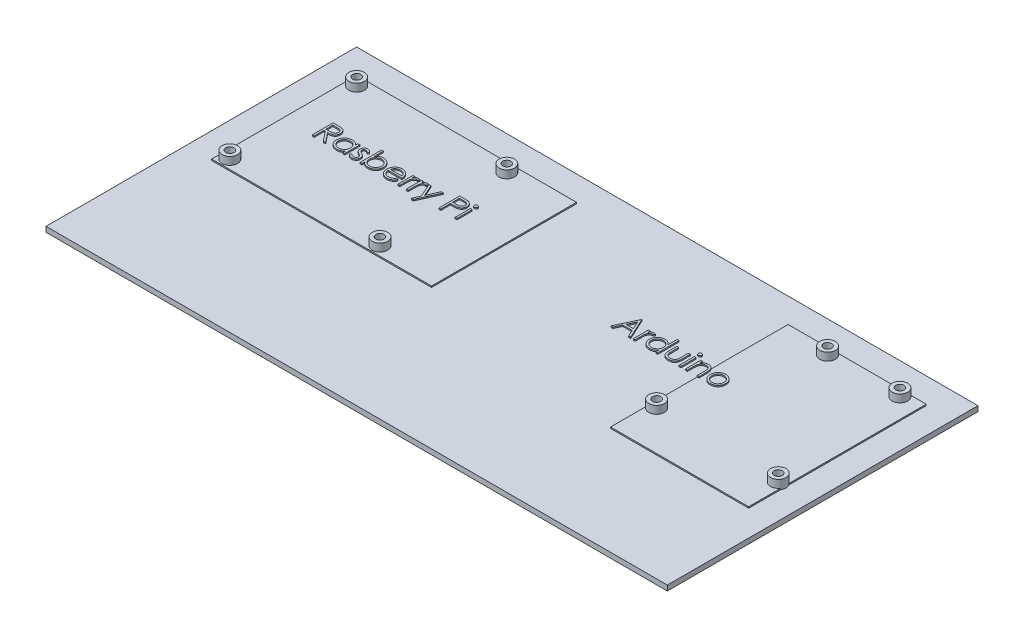
from build123d import *

# Parameters (mm, degrees)
SKETCH1_W            = 240
SKETCH1_H            = 120
BOSS_EXTRUDE1_DEPTH  = 2
SKETCH2_W            = 53.34
SKETCH2_H            = 68.58
BOSS_EXTRUDE2_DEPTH  = 0.5
SKETCH4_R            = 3
SKETCH4_R_2          = 1.5875
BOSS_EXTRUDE3_DEPTH  = 3
BOSS_EXTRUDE4_START  = -0.5
SKETCH4_2_R          = 3
SKETCH4_2_R_2        = 1.5875
BOSS_EXTRUDE4_DEPTH  = 0.5
SKETCH9_W            = 0.717948718
SKETCH9_H            = 5.846153846
BOSS_EXTRUDE6_DEPTH  = 0.5
SKETCH11_W           = 84.9241
SKETCH11_H           = 56
BOSS_EXTRUDE7_DEPTH  = 0.5
SKETCH13_R           = 3
SKETCH13_R_2         = 1.5875
BOSS_EXTRUDE10_DEPTH = 3
SKETCH12_W           = 0.717948717
SKETCH12_H           = 5.846153846
BOSS_EXTRUDE11_DEPTH = 0.5


with BuildPart() as part:
    # Sketch1 → Boss-Extrude1 (new body)
    with BuildSketch(Plane(origin=(0, 0, 0), x_dir=(1, 0, 0), z_dir=(0, 1, 0))):
        with Locations((39.300864109, -2.566255674)):
            Rectangle(SKETCH1_W, SKETCH1_H)
    extrude(amount=BOSS_EXTRUDE1_DEPTH)

    # Sketch2 → Boss-Extrude2 (add)
    with BuildSketch(Plane(origin=(0, 2, 0), x_dir=(1, 0, 0), z_dir=(0, 1, 0))):
        with Locations((122.630864109, 13.143744326)):
            Rectangle(SKETCH2_W, SKETCH2_H)
    extrude(amount=BOSS_EXTRUDE2_DEPTH)

    # Sketch4 → Boss-Extrude3 (add)
    # profile 1 of 4: a face of its own
    with BuildSketch(Plane(origin=(0, 2.5, 0), x_dir=(1, 0, 0), z_dir=(0, 1, 0))):
        with Locations((146.760864109, -7.176255674)):
            Circle(SKETCH4_R)
        with Locations((146.760864109, -7.176255674)):
            Circle(SKETCH4_R_2, mode=Mode.SUBTRACT)
    # profile 2 of 4: a face of its own
    with BuildSketch(Plane(origin=(0, 2.5, 0), x_dir=(1, 0, 0), z_dir=(0, 1, 0))):
        with Locations((98.500864109, -5.906255674)):
            Circle(SKETCH4_R)
        with Locations((98.500864109, -5.906255674)):
            Circle(SKETCH4_R_2, mode=Mode.SUBTRACT)
    # profile 3 of 4: a face of its own
    with BuildSketch(Plane(origin=(0, 2.5, 0), x_dir=(1, 0, 0), z_dir=(0, 1, 0))):
        with Locations((113.740864109, 44.893744326)):
            Circle(SKETCH4_R)
        with Locations((113.740864109, 44.893744326)):
            Circle(SKETCH4_R_2, mode=Mode.SUBTRACT)
    # profile 4 of 4: a face of its own
    with BuildSketch(Plane(origin=(0, 2.5, 0), x_dir=(1, 0, 0), z_dir=(0, 1, 0))):
        with Locations((141.680864109, 44.893744326)):
            Circle(SKETCH4_R)
        with Locations((141.680864109, 44.893744326)):
            Circle(SKETCH4_R_2, mode=Mode.SUBTRACT)
    extrude(amount=BOSS_EXTRUDE3_DEPTH)

    # Sketch4<2> → Boss-Extrude4 (add)
    # profile 1 of 4: a face of its own
    with BuildSketch(Plane(origin=(0, 2.5, 0), x_dir=(1, 0, 0), z_dir=(0, 1, 0)).offset(BOSS_EXTRUDE4_START)):
        with Locations((146.760864109, -7.176255674)):
            Circle(SKETCH4_2_R)
        with Locations((146.760864109, -7.176255674)):
            Circle(SKETCH4_2_R_2, mode=Mode.SUBTRACT)
    # profile 2 of 4: a face of its own
    with BuildSketch(Plane(origin=(0, 2.5, 0), x_dir=(1, 0, 0), z_dir=(0, 1, 0)).offset(BOSS_EXTRUDE4_START)):
        with Locations((98.500864109, -5.906255674)):
            Circle(SKETCH4_2_R)
        with Locations((98.500864109, -5.906255674)):
            Circle(SKETCH4_2_R_2, mode=Mode.SUBTRACT)
    # profile 3 of 4: a face of its own
    with BuildSketch(Plane(origin=(0, 2.5, 0), x_dir=(1, 0, 0), z_dir=(0, 1, 0)).offset(BOSS_EXTRUDE4_START)):
        with Locations((113.740864109, 44.893744326)):
            Circle(SKETCH4_2_R)
        with Locations((113.740864109, 44.893744326)):
            Circle(SKETCH4_2_R_2, mode=Mode.SUBTRACT)
    # profile 4 of 4: a face of its own
    with BuildSketch(Plane(origin=(0, 2.5, 0), x_dir=(1, 0, 0), z_dir=(0, 1, 0)).offset(BOSS_EXTRUDE4_START)):
        with Locations((141.680864109, 44.893744326)):
            Circle(SKETCH4_2_R)
        with Locations((141.680864109, 44.893744326)):
            Circle(SKETCH4_2_R_2, mode=Mode.SUBTRACT)
    extrude(amount=BOSS_EXTRUDE4_DEPTH)

    # Sketch9 → Boss-Extrude6 (add)
    # profile 1 of 8: a face of its own
    with BuildSketch(Plane(origin=(0, 2.5, 0), x_dir=(1, 0, 0), z_dir=(0, 1, 0))):
        Polygon((66.60485432, 20.257818585), (70.297162012, 12.257818585), (69.516713294, 12.257818585), (68.334020986, 14.821921149), (64.707418422, 14.821921149), (63.491072268, 12.257818585), (62.707418422, 12.257818585), (66.502290217, 20.257818585), align=None)
        Polygon((66.545559448, 18.698523713), (65.096841499, 15.64243397), (67.955815858, 15.64243397), align=None, mode=Mode.SUBTRACT)
    # profile 2 of 8: a face of its own
    with BuildSketch(Plane(origin=(0, 2.5, 0), x_dir=(1, 0, 0), z_dir=(0, 1, 0))):
        with BuildLine():
            Line((71.322803038, 18.103972431), (72.040751756, 18.103972431))
            Line((72.040751756, 18.103972431), (72.040751756, 17.243395508))
            add(Edge.make_bspline(
                [(72.040751756, 17.243395508), (72.093754633, 17.323523116), (72.195122223, 17.476766543), (72.363608919, 17.679439231), (72.536187962, 17.847245051), (72.713685533, 17.98096738), (72.897406904, 18.081111652), (73.083319937, 18.15446716), (73.274349582, 18.197843881), (73.402719695, 18.203635101), (73.467033807, 18.206536534)],
                knots=[0, 0, 0, 0, 1.2804753, 2.448899062, 3.506932113, 4.484331642, 5.4025378, 6.288909075, 7.142734305, 8, 8, 8, 8], degree=3))
            add(Edge.make_bspline(
                [(73.467033807, 18.206536534), (73.516922553, 18.20381533), (73.619571891, 18.198216277), (73.774960667, 18.158877249), (73.935059986, 18.09607034), (74.038242586, 18.037006974), (74.092033807, 18.006216021)],
                knots=[0, 0, 0, 0, 0.901110191, 1.854092781, 2.881294221, 4, 4, 4, 4], degree=3))
            Line((74.092033807, 18.006216021), (73.697803038, 17.384421149))
            add(Edge.make_bspline(
                [(73.697803038, 17.384421149), (73.663268132, 17.399827472), (73.59771427, 17.429071621), (73.501818119, 17.46368193), (73.413403635, 17.484061166), (73.357075502, 17.48714852), (73.330815858, 17.488587816)],
                knots=[0, 0, 0, 0, 1.180555205, 2.24091978, 3.179933427, 4, 4, 4, 4], degree=3))
            add(Edge.make_bspline(
                [(73.330815858, 17.488587816), (73.273202753, 17.48474773), (73.155688719, 17.476915069), (72.98315272, 17.415340651), (72.815730536, 17.315854388), (72.682766737, 17.205520418), (72.579813016, 17.099125453), (72.506349643, 17.006214818), (72.438960507, 16.902035089), (72.374571432, 16.78836724), (72.315905617, 16.663270449), (72.261152087, 16.527994533), (72.211646115, 16.38238281), (72.183416985, 16.28093705), (72.168956884, 16.228972431)],
                knots=[0, 0, 0, 0, 1.125678352, 2.296057538, 3.5422874, 4.923748041, 5.663163013, 6.437101912, 7.23742474, 8.08941207, 8.991984279, 9.93940061, 10.944477711, 12, 12, 12, 12], degree=3))
            add(Edge.make_bspline(
                [(72.168956884, 16.228972431), (72.158139985, 16.182624606), (72.134181375, 16.079967695), (72.110886431, 15.907742495), (72.08787039, 15.704259847), (72.071649548, 15.468953349), (72.056614024, 15.20241062), (72.048133836, 14.904225601), (72.041040943, 14.574092227), (72.040851076, 14.343293705), (72.040751756, 14.222562175)],
                knots=[0, 0, 0, 0, 0.566838948, 1.255505196, 2.06880316, 3.007127437, 4.065329342, 5.249902469, 6.561414163, 8, 8, 8, 8], degree=3))
            Line((72.040751756, 14.222562175), (72.040751756, 12.257818585))
            Line((72.040751756, 12.257818585), (71.322803038, 12.257818585))
            Line((71.322803038, 12.257818585), (71.322803038, 18.103972431))
        make_face()
    # profile 3 of 8: a face of its own
    with BuildSketch(Plane(origin=(0, 2.5, 0), x_dir=(1, 0, 0), z_dir=(0, 1, 0))):
        with BuildLine():
            Line((80.758700474, 20.46294679), (80.758700474, 12.257818585))
            Line((80.758700474, 12.257818585), (80.040751756, 12.257818585))
            Line((80.040751756, 12.257818585), (80.040751756, 13.269036534))
            add(Edge.make_bspline(
                [(80.040751756, 13.269036534), (79.95979452, 13.177517462), (79.801805456, 12.998916842), (79.537940044, 12.765586162), (79.258241352, 12.572721427), (78.964066903, 12.416950191), (78.655682347, 12.299939777), (78.33377129, 12.216771413), (77.99820242, 12.16329979), (77.76905418, 12.157960311), (77.652931243, 12.155254482)],
                knots=[0, 0, 0, 0, 1.074387032, 2.096679803, 3.090159297, 4.057316773, 5.018401886, 5.985159533, 6.978961417, 8, 8, 8, 8], degree=3))
            add(Edge.make_bspline(
                [(77.652931243, 12.155254482), (77.549690205, 12.158057619), (77.346094309, 12.163585529), (77.046599275, 12.206470794), (76.758388419, 12.275340786), (76.481189396, 12.371114248), (76.216795921, 12.498156126), (75.962944271, 12.650250407), (75.720949547, 12.831372305), (75.494500315, 13.038430655), (75.285970028, 13.263333483), (75.102972834, 13.503209019), (74.950394365, 13.757019999), (74.822805609, 14.021552922), (74.724528251, 14.298844167), (74.656017087, 14.587934836), (74.61318178, 14.888483119), (74.607656155, 15.093144886), (74.60485432, 15.196921149)],
                knots=[0, 0, 0, 0, 1.033919861, 2.038935746, 3.024066025, 3.998881131, 4.97069526, 5.957263378, 6.95902576, 7.993208707, 9.027059324, 10.027763471, 11.009749337, 11.988697705, 12.965288445, 13.950418724, 14.960734635, 16, 16, 16, 16], degree=3))
            add(Edge.make_bspline(
                [(74.60485432, 15.196921149), (74.607718254, 15.298552472), (74.613380099, 15.499472113), (74.655558887, 15.79496628), (74.726486907, 16.079579448), (74.826024844, 16.352395318), (74.953663598, 16.613744004), (75.108927797, 16.863810347), (75.291828654, 17.103283255), (75.502691298, 17.326531774), (75.73111363, 17.532750321), (75.975476444, 17.711970996), (76.229701087, 17.866752365), (76.497730825, 17.989388882), (76.775598493, 18.088609692), (77.065777798, 18.157256477), (77.367061406, 18.197707496), (77.571611102, 18.203565243), (77.67536714, 18.206536534)],
                knots=[0, 0, 0, 0, 1.020392517, 2.01726096, 2.990465484, 3.961182959, 4.928053699, 5.906110375, 6.912531644, 7.948652711, 8.985773172, 9.998621852, 10.987621588, 11.969261332, 12.953316658, 13.946091881, 14.958173133, 16, 16, 16, 16], degree=3))
            add(Edge.make_bspline(
                [(77.67536714, 18.206536534), (77.794719844, 18.2029546), (78.028995937, 18.195923662), (78.371621129, 18.137166252), (78.695707096, 18.038508245), (79.003119638, 17.903442459), (79.292026062, 17.727897885), (79.564544097, 17.515894576), (79.81593455, 17.261432527), (79.964670144, 17.07032036), (80.040751756, 16.972562175)],
                knots=[0, 0, 0, 0, 1.031072012, 2.023879775, 2.993683497, 3.952812103, 4.918022106, 5.908088563, 6.929940113, 8, 8, 8, 8], degree=3))
            Line((80.040751756, 16.972562175), (80.040751756, 20.46294679))
            Line((80.040751756, 20.46294679), (80.758700474, 20.46294679))
        make_face()
        with BuildLine():
            add(Edge.make_bspline(
                [(77.684982525, 17.488587816), (77.580035467, 17.484853787), (77.372886667, 17.477483407), (77.068786091, 17.41994399), (76.777784001, 17.324207774), (76.501335832, 17.193277714), (76.243808479, 17.028640602), (76.013651518, 16.829506011), (75.808982486, 16.601307122), (75.63684931, 16.345073727), (75.496528175, 16.070380947), (75.397860673, 15.783239374), (75.332788108, 15.488827997), (75.326140061, 15.289141858), (75.322803038, 15.188908329)],
                knots=[0, 0, 0, 0, 1.031046209, 2.035121221, 3.029706178, 4.034933723, 5.034054252, 6.02443088, 7.017295772, 8.038157696, 9.050218397, 10.03989886, 11.016116709, 12, 12, 12, 12], degree=3))
            add(Edge.make_bspline(
                [(75.322803038, 15.188908329), (75.327065651, 15.089273798), (75.33557417, 14.89039527), (75.396718614, 14.595582523), (75.499301182, 14.308373284), (75.639283039, 14.031205299), (75.814566753, 13.773870213), (76.017740816, 13.541321361), (76.25077003, 13.341345159), (76.508890047, 13.173944991), (76.784565408, 13.038716372), (77.074471537, 12.944623481), (77.37315871, 12.883874269), (77.576249758, 12.876778322), (77.678572268, 12.8732032)],
                knots=[0, 0, 0, 0, 0.979072187, 1.954306742, 2.945804271, 3.96968567, 4.997920485, 5.998718438, 6.996577872, 8.005894225, 9.015743152, 10.005417472, 10.995077863, 12, 12, 12, 12], degree=3))
            add(Edge.make_bspline(
                [(77.678572268, 12.8732032), (77.782449989, 12.876997404), (77.989052473, 12.884543698), (78.294055233, 12.942329447), (78.59004372, 13.037800986), (78.872985956, 13.170141847), (79.136565684, 13.33415866), (79.373132262, 13.526174869), (79.573168761, 13.749496432), (79.742751869, 13.994928325), (79.87572425, 14.263984317), (79.972583813, 14.550462467), (80.029849884, 14.854372749), (80.037067552, 15.062061725), (80.040751756, 15.168074995)],
                knots=[0, 0, 0, 0, 1.01762866, 2.023962475, 3.030623092, 4.058876274, 5.077231937, 6.066672613, 7.034107872, 8.005628644, 8.981990164, 9.965428785, 10.961468474, 12, 12, 12, 12], degree=3))
            add(Edge.make_bspline(
                [(80.040751756, 15.168074995), (80.038558255, 15.248847179), (80.034240753, 15.407832398), (80.001256594, 15.641266724), (79.948788191, 15.864658098), (79.874854088, 16.078241387), (79.777731152, 16.280835708), (79.660593401, 16.473895732), (79.521380945, 16.656417358), (79.362334782, 16.825887234), (79.188242891, 16.980462005), (79.004026798, 17.118437412), (78.807503948, 17.231783179), (78.601979292, 17.325591799), (78.387096242, 17.400241285), (78.161106253, 17.450041727), (77.926411426, 17.484236747), (77.766306157, 17.487122189), (77.684982525, 17.488587816)],
                knots=[0, 0, 0, 0, 1.050140795, 2.067009409, 3.05949893, 4.030605086, 5.00011959, 5.97591094, 6.962425594, 7.979863591, 8.993523472, 9.986985069, 10.967611495, 11.937549037, 12.921786183, 13.919465291, 14.943216303, 16, 16, 16, 16], degree=3))
        make_face(mode=Mode.SUBTRACT)
    # profile 4 of 8: a face of its own
    with BuildSketch(Plane(origin=(0, 2.5, 0), x_dir=(1, 0, 0), z_dir=(0, 1, 0))):
        with BuildLine():
            Line((82.297162012, 18.103972431), (83.01511073, 18.103972431))
            Line((83.01511073, 18.103972431), (83.01511073, 15.39243397))
            add(Edge.make_bspline(
                [(83.01511073, 15.39243397), (83.015435084, 15.312839114), (83.016055558, 15.160577885), (83.020263423, 14.941480315), (83.03016078, 14.741670686), (83.042535236, 14.561033573), (83.05844869, 14.399599535), (83.077382085, 14.257932434), (83.098544192, 14.134425727), (83.119258967, 14.060040914), (83.128892781, 14.02544679)],
                knots=[0, 0, 0, 0, 1.388932606, 2.656963016, 3.823490214, 4.879454478, 5.816252168, 6.653371382, 7.373723809, 8, 8, 8, 8], degree=3))
            add(Edge.make_bspline(
                [(83.128892781, 14.02544679), (83.144347536, 13.981965942), (83.174935744, 13.895908203), (83.230417992, 13.771590476), (83.29905419, 13.656446974), (83.374162368, 13.546037665), (83.460789585, 13.443633123), (83.557839805, 13.349406281), (83.662064347, 13.259796929), (83.816932972, 13.153774547), (84.02872558, 13.040139507), (84.30678902, 12.942091922), (84.608284394, 12.883495762), (84.816660895, 12.876697465), (84.923764576, 12.8732032)],
                knots=[0, 0, 0, 0, 0.725840625, 1.436591201, 2.137033971, 2.831655856, 3.53531722, 4.242432219, 4.957935707, 5.694543706, 7.190802206, 8.724350549, 10.316345118, 12, 12, 12, 12], degree=3))
            add(Edge.make_bspline(
                [(84.923764576, 12.8732032), (85.030858308, 12.876771769), (85.238064864, 12.883676288), (85.536247651, 12.940324376), (85.808822313, 13.034965951), (86.053053059, 13.167097178), (86.267832122, 13.328793322), (86.44681365, 13.518527741), (86.594487375, 13.730297769), (86.658966051, 13.88829612), (86.691392781, 13.967754482)],
                knots=[0, 0, 0, 0, 1.157059328, 2.238695713, 3.266970494, 4.264342957, 5.228770407, 6.160125903, 7.074715775, 8, 8, 8, 8], degree=3))
            add(Edge.make_bspline(
                [(86.691392781, 13.967754482), (86.700979593, 13.999677451), (86.722173692, 14.070251337), (86.744944781, 14.189976477), (86.765457836, 14.332752716), (86.782973667, 14.499514335), (86.795465468, 14.689825541), (86.802199243, 14.903626858), (86.809806729, 15.14024711), (86.809922195, 15.305887702), (86.809982525, 15.39243397)],
                knots=[0, 0, 0, 0, 0.557542046, 1.232589297, 2.036731608, 2.971723315, 4.038036528, 5.22795436, 6.551621927, 8, 8, 8, 8], degree=3))
            Line((86.809982525, 15.39243397), (86.809982525, 18.103972431))
            Line((86.809982525, 18.103972431), (87.527931243, 18.103972431))
            Line((87.527931243, 18.103972431), (87.527931243, 15.257818585))
            add(Edge.make_bspline(
                [(87.527931243, 15.257818585), (87.526921655, 15.161116479), (87.524962916, 14.973501165), (87.512374702, 14.700851767), (87.490775587, 14.446766636), (87.457992307, 14.211111276), (87.419442194, 13.994065604), (87.36971357, 13.795351441), (87.310334741, 13.615581032), (87.243350707, 13.451599828), (87.164215009, 13.302921213), (87.080038962, 13.161810775), (86.982839484, 13.03176978), (86.88050752, 12.906324895), (86.766675164, 12.79171569), (86.643475486, 12.685312316), (86.512642526, 12.585488244), (86.371272931, 12.496136748), (86.221430501, 12.415641559), (86.062930257, 12.344290523), (85.893830832, 12.28782749), (85.716313948, 12.239117396), (85.529509881, 12.200912895), (85.33359872, 12.173972171), (85.128646454, 12.157457129), (84.988967689, 12.156001027), (84.91735432, 12.155254482)],
                knots=[0, 0, 0, 0, 1.493040784, 2.896703357, 4.213163133, 5.428574705, 6.569057535, 7.615249723, 8.588095153, 9.490268104, 10.346124644, 11.18633936, 12.024365274, 12.850166724, 13.684164916, 14.514361689, 15.362232829, 16.222528818, 17.093394965, 17.986930858, 18.902426812, 19.842810585, 20.827885679, 21.843828298, 22.894529745, 24, 24, 24, 24], degree=3))
            add(Edge.make_bspline(
                [(84.91735432, 12.155254482), (84.846276573, 12.156030956), (84.706602184, 12.157556799), (84.50163934, 12.17388093), (84.305185383, 12.200871035), (84.117938758, 12.239397246), (83.939711564, 12.287486549), (83.769781873, 12.344637487), (83.610139443, 12.415678588), (83.458866291, 12.495627291), (83.317146547, 12.586062206), (83.18432694, 12.685189154), (83.060585563, 12.792860155), (82.945895121, 12.908625543), (82.841865461, 13.033921397), (82.747200222, 13.167739821), (82.660442039, 13.308754881), (82.581921376, 13.459756395), (82.514465934, 13.625635274), (82.454911087, 13.809171496), (82.406201056, 14.012377249), (82.366561128, 14.2350788), (82.334672121, 14.476210323), (82.312532368, 14.737166701), (82.300153326, 15.017312283), (82.298180614, 15.210797746), (82.297162012, 15.3107032)],
                knots=[0, 0, 0, 0, 1.083640291, 2.129454052, 3.13281866, 4.105697902, 5.042300162, 5.946461698, 6.836384745, 7.703652036, 8.553297018, 9.397182691, 10.228592656, 11.052265423, 11.879314572, 12.708807002, 13.549817954, 14.402308542, 15.300838682, 16.27712199, 17.341985831, 18.484375296, 19.725102775, 21.0496083, 22.476576903, 24, 24, 24, 24], degree=3))
            Line((82.297162012, 15.3107032), (82.297162012, 18.103972431))
        make_face()
    # profile 5 of 8: a face of its own
    with BuildSketch(Plane(origin=(0, 2.5, 0), x_dir=(1, 0, 0), z_dir=(0, 1, 0))):
        with BuildLine():
            add(Edge.make_bspline(
                [(89.422162012, 20.565510893), (89.466713591, 20.563444259), (89.553954139, 20.559397392), (89.68011018, 20.524742587), (89.79498335, 20.466000449), (89.896875311, 20.38718975), (89.984308195, 20.294505308), (90.045521247, 20.186480238), (90.084863867, 20.069774777), (90.08961485, 19.988368859), (90.092033807, 19.946921149)],
                knots=[0, 0, 0, 0, 1.055194115, 2.066272739, 3.074728998, 4.095836921, 5.109056067, 6.073838105, 7.019297344, 8, 8, 8, 8], degree=3))
            add(Edge.make_bspline(
                [(90.092033807, 19.946921149), (90.089560299, 19.90654937), (90.084670466, 19.826739142), (90.045551636, 19.71205692), (89.98378652, 19.605532843), (89.896931376, 19.513028363), (89.794968494, 19.434261232), (89.680114126, 19.375507543), (89.553953101, 19.3408558), (89.46671324, 19.336808512), (89.422162012, 19.334741662)],
                knots=[0, 0, 0, 0, 0.96129708, 1.900370562, 2.859976407, 3.87933698, 4.906634145, 5.921202961, 6.938410037, 8, 8, 8, 8], degree=3))
            add(Edge.make_bspline(
                [(89.422162012, 19.334741662), (89.37812024, 19.336729594), (89.292398686, 19.340598844), (89.168131617, 19.376187456), (89.054237927, 19.434281337), (88.952147247, 19.512512617), (88.867049663, 19.606100954), (88.805110633, 19.711991911), (88.766082149, 19.826755693), (88.761180141, 19.90655493), (88.758700474, 19.946921149)],
                knots=[0, 0, 0, 0, 1.054934014, 2.053291228, 3.073705704, 4.106921865, 5.123545215, 6.088680038, 7.033164197, 8, 8, 8, 8], degree=3))
            add(Edge.make_bspline(
                [(88.758700474, 19.946921149), (88.761125814, 19.988363091), (88.765889337, 20.06975768), (88.805139888, 20.186546327), (88.866533734, 20.293932616), (88.952203594, 20.387705186), (89.054222932, 20.465980466), (89.168135492, 20.524062709), (89.292397662, 20.559654342), (89.378119893, 20.563523175), (89.422162012, 20.565510893)],
                knots=[0, 0, 0, 0, 0.98631895, 1.937192651, 2.907499808, 3.917963147, 4.944918757, 5.95915025, 6.951458133, 8, 8, 8, 8], degree=3))
        make_face()
    # profile 6 of 8: a face of its own
    with BuildSketch(Plane(origin=(0, 2.5, 0), x_dir=(1, 0, 0), z_dir=(0, 1, 0))):
        with Locations((89.42536714, 15.180895508)):
            Rectangle(SKETCH9_W, SKETCH9_H)
    # profile 7 of 8: a face of its own
    with BuildSketch(Plane(origin=(0, 2.5, 0), x_dir=(1, 0, 0), z_dir=(0, 1, 0))):
        with BuildLine():
            Line((91.527931243, 18.103972431), (92.245879961, 18.103972431))
            Line((92.245879961, 18.103972431), (92.245879961, 17.049485252))
            add(Edge.make_bspline(
                [(92.245879961, 17.049485252), (92.322537412, 17.145125761), (92.471293872, 17.330719506), (92.719029491, 17.574652248), (92.98084412, 17.775669905), (93.255134414, 17.935907148), (93.542272723, 18.056699437), (93.840508768, 18.143935851), (94.151628097, 18.19624403), (94.363203952, 18.203078842), (94.470238935, 18.206536534)],
                knots=[0, 0, 0, 0, 1.12780773, 2.188550248, 3.19190651, 4.159438251, 5.104880172, 6.052711206, 7.014878035, 8, 8, 8, 8], degree=3))
            add(Edge.make_bspline(
                [(94.470238935, 18.206536534), (94.578423242, 18.202547516), (94.790166025, 18.194740045), (95.098458737, 18.132987608), (95.386397922, 18.027512739), (95.652956907, 17.883028007), (95.89324768, 17.703356068), (96.104275912, 17.494035424), (96.278820478, 17.253267233), (96.395843022, 17.029900019), (96.472930217, 16.831754204), (96.521461274, 16.662047346), (96.562674946, 16.472977286), (96.598404655, 16.265115369), (96.622580911, 16.037005219), (96.641649006, 15.789581923), (96.655314593, 15.522925625), (96.65585678, 15.338499048), (96.656136371, 15.243395508)],
                knots=[0, 0, 0, 0, 1.235846778, 2.418850247, 3.575807741, 4.728682307, 5.871620074, 6.994088408, 8.11269785, 9.256955736, 9.865816715, 10.540099792, 11.271859618, 12.076849838, 12.949306005, 13.892391288, 14.913166135, 16, 16, 16, 16], degree=3))
            Line((96.656136371, 15.243395508), (96.656136371, 12.257818585))
            Line((96.656136371, 12.257818585), (95.938187653, 12.257818585))
            Line((95.938187653, 12.257818585), (95.938187653, 15.007818585))
            add(Edge.make_bspline(
                [(95.938187653, 15.007818585), (95.937746035, 15.087412745), (95.936901294, 15.239662827), (95.934236959, 15.457649165), (95.927814544, 15.655332773), (95.918789828, 15.832241041), (95.905580616, 15.988204096), (95.891814601, 16.123539586), (95.874980369, 16.238075683), (95.859979424, 16.307024443), (95.853251756, 16.33794679)],
                knots=[0, 0, 0, 0, 1.430800155, 2.736877192, 3.918605307, 4.986035426, 5.920637409, 6.731861385, 7.431261377, 8, 8, 8, 8], degree=3))
            add(Edge.make_bspline(
                [(95.853251756, 16.33794679), (95.828964826, 16.428715213), (95.782220002, 16.603416343), (95.666713755, 16.840386292), (95.52085277, 17.04198215), (95.342800543, 17.206957514), (95.134276942, 17.335347998), (94.895860615, 17.424431323), (94.629852294, 17.48014851), (94.442756562, 17.48569624), (94.345238935, 17.488587816)],
                knots=[0, 0, 0, 0, 1.084156227, 2.086665306, 3.027808233, 3.945421172, 4.874247719, 5.839848303, 6.874090471, 8, 8, 8, 8], degree=3))
            add(Edge.make_bspline(
                [(94.345238935, 17.488587816), (94.28748423, 17.487499805), (94.17318916, 17.48534666), (94.00370351, 17.463743693), (93.8393054, 17.42841008), (93.678344922, 17.380710338), (93.524041394, 17.315196579), (93.371437299, 17.240843733), (93.226278981, 17.148162106), (93.085471217, 17.044869257), (92.954470513, 16.930402497), (92.832577168, 16.809615046), (92.723918836, 16.680985094), (92.62547615, 16.546585214), (92.540497262, 16.404569584), (92.466318775, 16.256308312), (92.403380044, 16.101606258), (92.372105319, 15.994234689), (92.356456884, 15.940510893)],
                knots=[0, 0, 0, 0, 1.023777757, 2.026029729, 3.023749952, 4.003683103, 4.997618607, 5.993177895, 7.010360494, 8.046726602, 9.087585522, 10.09234134, 11.086953743, 12.070360549, 13.043493632, 14.017870808, 15.008233677, 16, 16, 16, 16], degree=3))
            add(Edge.make_bspline(
                [(92.356456884, 15.940510893), (92.347451973, 15.901070429), (92.327848753, 15.815210601), (92.30667577, 15.674309071), (92.287458455, 15.511314843), (92.271373978, 15.326418118), (92.261533026, 15.118971546), (92.250802976, 14.88986106), (92.246896551, 14.638173087), (92.246228313, 14.46294636), (92.245879961, 14.371600636)],
                knots=[0, 0, 0, 0, 0.615963638, 1.340920617, 2.168419149, 3.115676021, 4.16674242, 5.331190069, 6.6087489, 8, 8, 8, 8], degree=3))
            Line((92.245879961, 14.371600636), (92.245879961, 12.257818585))
            Line((92.245879961, 12.257818585), (91.527931243, 12.257818585))
            Line((91.527931243, 12.257818585), (91.527931243, 18.103972431))
        make_face()
    # profile 8 of 8: a face of its own
    with BuildSketch(Plane(origin=(0, 2.5, 0), x_dir=(1, 0, 0), z_dir=(0, 1, 0))):
        with BuildLine():
            add(Edge.make_bspline(
                [(101.120879961, 18.206536534), (101.230574299, 18.204200783), (101.445658087, 18.199620945), (101.760647541, 18.150672452), (102.061322137, 18.075821334), (102.348833434, 17.972343478), (102.619499252, 17.833641876), (102.877262096, 17.668134925), (103.121415259, 17.472060426), (103.267753611, 17.320384841), (103.342033807, 17.243395508)],
                knots=[0, 0, 0, 0, 1.054011418, 2.066658804, 3.057071809, 4.030435133, 4.997543892, 5.974964718, 6.972108034, 8, 8, 8, 8], degree=3))
            add(Edge.make_bspline(
                [(103.342033807, 17.243395508), (103.405992559, 17.169763541), (103.532672285, 17.023924587), (103.695108214, 16.787454614), (103.835043209, 16.542562956), (103.947187119, 16.285997638), (104.035610031, 16.019998389), (104.098388765, 15.743650935), (104.135730331, 15.45756557), (104.140765684, 15.263271083), (104.143315858, 15.164869867)],
                knots=[0, 0, 0, 0, 1.025258237, 2.030674902, 3.01204498, 3.988269485, 4.97094183, 5.956517959, 6.965070386, 8, 8, 8, 8], degree=3))
            add(Edge.make_bspline(
                [(104.143315858, 15.164869867), (104.141072801, 15.065898307), (104.136640417, 14.870325888), (104.094712151, 14.582281623), (104.02949824, 14.302979171), (103.936168324, 14.033587871), (103.816492646, 13.773284266), (103.670456789, 13.523205296), (103.49703595, 13.282857563), (103.300455386, 13.054281932), (103.083193954, 12.843616298), (102.847499901, 12.660008825), (102.598004967, 12.502702484), (102.331391588, 12.375990677), (102.050094475, 12.27608279), (101.753506891, 12.205911324), (101.442089587, 12.163484618), (101.229455938, 12.158036451), (101.120879961, 12.155254482)],
                knots=[0, 0, 0, 0, 0.998656419, 1.973391657, 2.932242238, 3.890759089, 4.846373663, 5.82037756, 6.809684879, 7.83454468, 8.860553229, 9.859544525, 10.845671541, 11.83227036, 12.833544569, 13.85385346, 14.904124723, 16, 16, 16, 16], degree=3))
            add(Edge.make_bspline(
                [(101.120879961, 12.155254482), (101.01177203, 12.158045788), (100.798078637, 12.163512701), (100.485562107, 12.20574649), (100.188442978, 12.27605045), (99.90677761, 12.376319005), (99.639017959, 12.502706534), (99.388077395, 12.659533253), (99.152191874, 12.843670751), (98.934884481, 13.054267178), (98.73831624, 13.282861364), (98.564892221, 13.523204309), (98.41885719, 13.773284523), (98.299181295, 14.033587803), (98.205851437, 14.302979189), (98.140637511, 14.582281618), (98.098709249, 14.870325889), (98.094276864, 15.065898307), (98.092033807, 15.164869867)],
                knots=[0, 0, 0, 0, 1.099876186, 2.154163076, 3.173186993, 4.173200201, 5.163417411, 6.152872554, 7.150605724, 8.17532212, 9.198891216, 10.186952605, 11.159729845, 12.11414092, 13.071450619, 14.029093627, 15.002601286, 16, 16, 16, 16], degree=3))
            add(Edge.make_bspline(
                [(98.092033807, 15.164869867), (98.094601373, 15.262736258), (98.099684714, 15.456494892), (98.136988735, 15.742042459), (98.199522578, 16.017922205), (98.288051484, 16.282894722), (98.401229063, 16.538335719), (98.539197722, 16.783832475), (98.703290596, 17.019233162), (98.829466485, 17.164883631), (98.893315858, 17.238587816)],
                knots=[0, 0, 0, 0, 1.031353054, 2.041901799, 3.029428768, 4.008703097, 4.981709435, 5.96992636, 6.972712378, 8, 8, 8, 8], degree=3))
            add(Edge.make_bspline(
                [(98.893315858, 17.238587816), (98.967484066, 17.31624482), (99.113348898, 17.468970983), (99.358717418, 17.664473895), (99.615846152, 17.833424921), (99.889503126, 17.969370556), (100.17677823, 18.076430025), (100.478993642, 18.150865488), (100.795051963, 18.199444585), (101.01118824, 18.204148992), (101.120879961, 18.206536534)],
                knots=[0, 0, 0, 0, 1.027980169, 2.021703884, 2.998553061, 3.971491411, 4.943284454, 5.930300938, 6.949603206, 8, 8, 8, 8], degree=3))
        make_face()
        with BuildLine():
            add(Edge.make_bspline(
                [(101.117674833, 17.488587816), (101.04010315, 17.486383035), (100.886962284, 17.482030389), (100.66154609, 17.448924321), (100.444540024, 17.396472883), (100.235532381, 17.321949326), (100.035227986, 17.225723271), (99.843435067, 17.107532734), (99.65958949, 16.968943119), (99.487287631, 16.810171298), (99.329156631, 16.636733596), (99.190921256, 16.451937347), (99.073378156, 16.258779984), (98.975457793, 16.057060645), (98.902527077, 15.844735127), (98.849560169, 15.62420797), (98.816485333, 15.395029875), (98.812173611, 15.239233262), (98.809982525, 15.160062175)],
                knots=[0, 0, 0, 0, 1.021534396, 2.016698045, 2.994645724, 3.958388632, 4.93408049, 5.916473867, 6.921342795, 7.962252576, 8.998418191, 10.008913653, 10.997312074, 11.973003931, 12.956656626, 13.948281152, 14.957379055, 16, 16, 16, 16], degree=3))
            add(Edge.make_bspline(
                [(98.809982525, 15.160062175), (98.813655265, 15.057771827), (98.820944966, 14.854744614), (98.880225507, 14.555747763), (98.979394146, 14.268703529), (99.113307929, 13.995294647), (99.281093571, 13.74232944), (99.478778295, 13.516794618), (99.704240467, 13.322084192), (99.954792468, 13.160527974), (100.225316623, 13.032162818), (100.511616786, 12.941193731), (100.810224086, 12.882058434), (101.014294329, 12.876180778), (101.117674833, 12.8732032)],
                knots=[0, 0, 0, 0, 1.016792936, 2.018143844, 3.017858371, 4.030088057, 5.03801393, 6.028138512, 7.003788237, 7.991172063, 8.984598303, 9.972568034, 10.972917682, 12, 12, 12, 12], degree=3))
            add(Edge.make_bspline(
                [(101.117674833, 12.8732032), (101.22104939, 12.876198127), (101.425107895, 12.882110028), (101.723300299, 12.940895902), (102.008817949, 13.032561412), (102.279061121, 13.160383606), (102.529499072, 13.322697697), (102.756582777, 13.51569513), (102.952579603, 13.74292679), (103.120199271, 13.995629713), (103.256306112, 14.268279661), (103.355010573, 14.555800741), (103.414433626, 14.854731122), (103.421704092, 15.057767307), (103.42536714, 15.160062175)],
                knots=[0, 0, 0, 0, 1.02726834, 2.027799167, 3.010890988, 4.004497153, 4.992059811, 5.971914811, 6.958719428, 7.966827853, 8.981595046, 9.981490638, 10.983022906, 12, 12, 12, 12], degree=3))
            add(Edge.make_bspline(
                [(103.42536714, 15.160062175), (103.423176809, 15.239233735), (103.418866571, 15.39503128), (103.385780938, 15.624202602), (103.33285399, 15.844754823), (103.259776008, 16.056987973), (103.162281119, 16.259302269), (103.042471306, 16.451370216), (102.904800391, 16.63737375), (102.744761258, 16.809610644), (102.572639251, 16.969005013), (102.388719164, 17.107586474), (102.197210641, 17.225203835), (101.997488167, 17.322772385), (101.788453726, 17.395794877), (101.571751717, 17.449227178), (101.347297294, 17.481890485), (101.194705195, 17.486341094), (101.117674833, 17.488587816)],
                knots=[0, 0, 0, 0, 1.042956736, 2.052379634, 3.044323526, 4.02829302, 5.004299113, 5.996692471, 7.007513377, 8.048758398, 9.090003419, 10.095195979, 11.07790575, 12.047570684, 13.018257071, 13.989683339, 14.985167495, 16, 16, 16, 16], degree=3))
        make_face(mode=Mode.SUBTRACT)
    extrude(amount=BOSS_EXTRUDE6_DEPTH)


with BuildPart() as boss_extrude6_piece_1:
    # of the separate pieces the step leaves, piece 1, a body of its own (boss_extrude6_pieces)
    add(part.part.solids().sort_by_distance((-80.699135891, 0, -57.433744326))[0])

    # Sketch11 → Boss-Extrude7 (add)
    with BuildSketch(Plane(origin=(0, 2, 0), x_dir=(1, 0, 0), z_dir=(0, 1, 0))):
        with Locations((-28.237085891, 19.433744326)):
            Rectangle(SKETCH11_W, SKETCH11_H)
    extrude(amount=BOSS_EXTRUDE7_DEPTH)

    # Sketch13 → Boss-Extrude10 (add)
    # profile 1 of 4: a face of its own
    with BuildSketch(Plane(origin=(0, 2.5, 0), x_dir=(1, 0, 0), z_dir=(0, 1, 0))):
        with Locations((-67.199135891, 43.933744326)):
            Circle(SKETCH13_R)
        with Locations((-67.199135891, 43.933744326)):
            Circle(SKETCH13_R_2, mode=Mode.SUBTRACT)
    # profile 2 of 4: a face of its own
    with BuildSketch(Plane(origin=(0, 2.5, 0), x_dir=(1, 0, 0), z_dir=(0, 1, 0))):
        with Locations((-9.199135891, 43.933744326)):
            Circle(SKETCH13_R)
        with Locations((-9.199135891, 43.933744326)):
            Circle(SKETCH13_R_2, mode=Mode.SUBTRACT)
    # profile 3 of 4: a face of its own
    with BuildSketch(Plane(origin=(0, 2.5, 0), x_dir=(1, 0, 0), z_dir=(0, 1, 0))):
        with Locations((-67.199135891, -5.066255674)):
            Circle(SKETCH13_R)
        with Locations((-67.199135891, -5.066255674)):
            Circle(SKETCH13_R_2, mode=Mode.SUBTRACT)
    # profile 4 of 4: a face of its own
    with BuildSketch(Plane(origin=(0, 2.5, 0), x_dir=(1, 0, 0), z_dir=(0, 1, 0))):
        with Locations((-9.199135891, -5.066255674)):
            Circle(SKETCH13_R)
        with Locations((-9.199135891, -5.066255674)):
            Circle(SKETCH13_R_2, mode=Mode.SUBTRACT)
    extrude(amount=BOSS_EXTRUDE10_DEPTH)

    # Sketch12 → Boss-Extrude11 (add)
    # profile 1 of 11: a face of its own
    with BuildSketch(Plane(origin=(0, 2.5, 0), x_dir=(1, 0, 0), z_dir=(0, 1, 0))):
        with BuildLine():
            Line((-58.876068259, 26.50490163), (-57.275106721, 26.50490163))
            add(Edge.make_bspline(
                [(-57.275106721, 26.50490163), (-57.168269855, 26.504546005), (-56.96313124, 26.503863165), (-56.669249479, 26.500055707), (-56.402216114, 26.489142894), (-56.162170767, 26.479751846), (-55.949117841, 26.462627409), (-55.762404034, 26.446260215), (-55.602889297, 26.424834705), (-55.506327351, 26.404936595), (-55.462606721, 26.395927271)],
                knots=[0, 0, 0, 0, 1.410062039, 2.707475311, 3.878576406, 4.937260626, 5.877586885, 6.699081471, 7.410979367, 8, 8, 8, 8], degree=3))
            add(Edge.make_bspline(
                [(-55.462606721, 26.395927271), (-55.404077294, 26.381466093), (-55.288267032, 26.352852233), (-55.121524024, 26.292373145), (-54.962634141, 26.222385432), (-54.8122574, 26.140182643), (-54.67114702, 26.045154575), (-54.537848024, 25.938941724), (-54.411755536, 25.822125253), (-54.297968953, 25.691759901), (-54.190679692, 25.554990736), (-54.100191402, 25.407096435), (-54.02218802, 25.252441515), (-53.960083981, 25.089453131), (-53.910077185, 24.919711939), (-53.874817209, 24.741680403), (-53.853671637, 24.556169603), (-53.851518825, 24.42963724), (-53.850427233, 24.365478553)],
                knots=[0, 0, 0, 0, 1.027469482, 2.033020251, 3.019912614, 3.986113645, 4.951240523, 5.91722682, 6.890402269, 7.87763091, 8.8651537, 9.85103654, 10.82876324, 11.815024772, 12.821070561, 13.842952187, 14.906261191, 16, 16, 16, 16], degree=3))
            add(Edge.make_bspline(
                [(-53.850427233, 24.365478553), (-53.853784943, 24.258884028), (-53.860336705, 24.050890501), (-53.921422656, 23.749037058), (-54.021483273, 23.467461482), (-54.159365076, 23.206518309), (-54.334952449, 22.971293977), (-54.545980543, 22.764687222), (-54.792567084, 22.591795993), (-55.022119806, 22.471903868), (-55.22489512, 22.395120077), (-55.391828406, 22.341094114), (-55.573924355, 22.299352479), (-55.769438262, 22.261957892), (-55.97918376, 22.233725448), (-56.202658136, 22.213047518), (-56.440020769, 22.200123978), (-56.603081498, 22.198199395), (-56.686965695, 22.197209322)],
                knots=[0, 0, 0, 0, 1.260483769, 2.459530307, 3.627416485, 4.787058657, 5.939039949, 7.08810263, 8.267026773, 9.491475466, 10.141966685, 10.831826277, 11.566392101, 12.351337768, 13.187381173, 14.07005841, 15.007169909, 16, 16, 16, 16], degree=3))
            Line((-56.686965695, 22.197209322), (-53.747863131, 18.50490163))
            Line((-53.747863131, 18.50490163), (-54.635683644, 18.50490163))
            Line((-54.635683644, 18.50490163), (-57.574786208, 22.197209322))
            Line((-57.574786208, 22.197209322), (-58.158119541, 22.197209322))
            Line((-58.158119541, 22.197209322), (-58.158119541, 18.50490163))
            Line((-58.158119541, 18.50490163), (-58.876068259, 18.50490163))
            Line((-58.876068259, 18.50490163), (-58.876068259, 26.50490163))
        make_face()
        with BuildLine():
            Line((-58.158119541, 25.684388809), (-58.158119541, 23.017722143))
            Line((-58.158119541, 23.017722143), (-56.693375951, 23.006504194))
            add(Edge.make_bspline(
                [(-56.693375951, 23.006504194), (-56.624987291, 23.006473939), (-56.492430589, 23.006415295), (-56.300657641, 23.015543927), (-56.122097385, 23.025928654), (-55.957432809, 23.041812873), (-55.806590351, 23.062283894), (-55.669645407, 23.087890715), (-55.546374431, 23.117724001), (-55.402606343, 23.163899146), (-55.2420657, 23.237055759), (-55.067593792, 23.343491184), (-54.91901702, 23.477363457), (-54.793490477, 23.630445642), (-54.692623205, 23.798757068), (-54.621509938, 23.980280197), (-54.576384356, 24.170432422), (-54.571061966, 24.301125239), (-54.568375951, 24.367081117)],
                knots=[0, 0, 0, 0, 1.146690395, 2.22261258, 3.21895312, 4.145990853, 4.996080663, 5.770904154, 6.481378293, 7.121626537, 8.300444488, 9.431385265, 10.535395872, 11.636531494, 12.74115979, 13.810798291, 14.895190096, 16, 16, 16, 16], degree=3))
            add(Edge.make_bspline(
                [(-54.568375951, 24.367081117), (-54.571123657, 24.431416143), (-54.576568606, 24.558904688), (-54.621022934, 24.745546769), (-54.696198663, 24.921699798), (-54.797506635, 25.086647192), (-54.920933275, 25.236374588), (-55.065659704, 25.364482367), (-55.227728722, 25.470195429), (-55.379205746, 25.537748298), (-55.514598232, 25.579165106), (-55.632151741, 25.608310623), (-55.764977976, 25.631726552), (-55.913721881, 25.650487834), (-56.077748466, 25.666613421), (-56.257887097, 25.677474629), (-56.452942594, 25.683906319), (-56.58813558, 25.684224236), (-56.658119541, 25.684388809)],
                knots=[0, 0, 0, 0, 1.101028733, 2.181837193, 3.264309656, 4.369019818, 5.486613113, 6.575447106, 7.666700264, 8.788928104, 9.402425223, 10.0903467, 10.862060571, 11.710948788, 12.657782767, 13.684531032, 14.801375019, 16, 16, 16, 16], degree=3))
            Line((-56.658119541, 25.684388809), (-58.158119541, 25.684388809))
        make_face(mode=Mode.SUBTRACT)
    # profile 2 of 11: a face of its own
    with BuildSketch(Plane(origin=(0, 2.5, 0), x_dir=(1, 0, 0), z_dir=(0, 1, 0))):
        with BuildLine():
            Line((-46.363247746, 24.351055476), (-46.363247746, 18.50490163))
            Line((-46.363247746, 18.50490163), (-47.081196464, 18.50490163))
            Line((-47.081196464, 18.50490163), (-47.081196464, 19.516119578))
            add(Edge.make_bspline(
                [(-47.081196464, 19.516119578), (-47.1621537, 19.424600507), (-47.320142763, 19.245999887), (-47.584008176, 19.012669207), (-47.863706868, 18.819804472), (-48.157881316, 18.664033236), (-48.466265873, 18.547022822), (-48.788176929, 18.463854458), (-49.1237458, 18.410382835), (-49.352894039, 18.405043356), (-49.469016977, 18.402337527)],
                knots=[0, 0, 0, 0, 1.074387032, 2.096679803, 3.090159297, 4.057316773, 5.018401886, 5.985159533, 6.978961417, 8, 8, 8, 8], degree=3))
            add(Edge.make_bspline(
                [(-49.469016977, 18.402337527), (-49.572258014, 18.405140664), (-49.775853911, 18.410668573), (-50.075348945, 18.453553839), (-50.3635598, 18.522423831), (-50.640758824, 18.618197293), (-50.905152299, 18.745239171), (-51.159003949, 18.897333452), (-51.400998673, 19.078455349), (-51.627447905, 19.2855137), (-51.835978192, 19.510416528), (-52.018975386, 19.750292063), (-52.171553854, 20.004103044), (-52.29914261, 20.268635967), (-52.397419969, 20.545927212), (-52.465931133, 20.835017881), (-52.50876644, 21.135566164), (-52.514292064, 21.340227931), (-52.5170939, 21.444004194)],
                knots=[0, 0, 0, 0, 1.033919861, 2.038935746, 3.024066025, 3.998881131, 4.97069526, 5.957263378, 6.95902576, 7.993208707, 9.027059324, 10.027763471, 11.009749337, 11.988697705, 12.965288445, 13.950418724, 14.960734635, 16, 16, 16, 16], degree=3))
            add(Edge.make_bspline(
                [(-52.5170939, 21.444004194), (-52.514229965, 21.545635516), (-52.508568121, 21.746555158), (-52.466389333, 22.042049325), (-52.395461313, 22.326662492), (-52.295923376, 22.599478363), (-52.168284621, 22.860827049), (-52.013020423, 23.110893392), (-51.830119566, 23.3503663), (-51.619256922, 23.573614818), (-51.39083459, 23.779833365), (-51.146471776, 23.959054041), (-50.892247133, 24.113835409), (-50.624217395, 24.236471927), (-50.346349727, 24.335692737), (-50.056170422, 24.404339521), (-49.754886814, 24.444790541), (-49.550337118, 24.450648288), (-49.446581079, 24.453619578)],
                knots=[0, 0, 0, 0, 1.020392517, 2.01726096, 2.990465484, 3.961182959, 4.928053699, 5.906110375, 6.912531644, 7.948652711, 8.985773172, 9.998621852, 10.987621588, 11.969261332, 12.953316658, 13.946091881, 14.958173133, 16, 16, 16, 16], degree=3))
            add(Edge.make_bspline(
                [(-49.446581079, 24.453619578), (-49.327267116, 24.450333289), (-49.093298065, 24.443889031), (-48.751062615, 24.39025994), (-48.427303808, 24.299657729), (-48.119522432, 24.176417734), (-47.828823721, 24.01264921), (-47.557959757, 23.806066442), (-47.304095795, 23.557972301), (-47.156940843, 23.367411285), (-47.081196464, 23.269324707)],
                knots=[0, 0, 0, 0, 1.038897134, 2.037228247, 3.008116434, 3.962042015, 4.918381754, 5.904844433, 6.921570401, 8, 8, 8, 8], degree=3))
            Line((-47.081196464, 23.269324707), (-47.081196464, 24.351055476))
            Line((-47.081196464, 24.351055476), (-46.363247746, 24.351055476))
        make_face()
        with BuildLine():
            add(Edge.make_bspline(
                [(-49.436965695, 23.735670861), (-49.541912753, 23.731936831), (-49.749061553, 23.724566452), (-50.053162129, 23.667027034), (-50.344164218, 23.571290819), (-50.620612388, 23.440360759), (-50.87813974, 23.275723647), (-51.108296702, 23.076589056), (-51.312965734, 22.848390167), (-51.485098909, 22.592156772), (-51.625420045, 22.317463992), (-51.724087547, 22.030322419), (-51.789160112, 21.735911042), (-51.795808159, 21.536224903), (-51.799145182, 21.435991373)],
                knots=[0, 0, 0, 0, 1.031046209, 2.035121221, 3.029706178, 4.034933723, 5.034054252, 6.02443088, 7.017295772, 8.038157696, 9.050218397, 10.03989886, 11.016116709, 12, 12, 12, 12], degree=3))
            add(Edge.make_bspline(
                [(-51.799145182, 21.435991373), (-51.794882569, 21.336356843), (-51.78637405, 21.137478315), (-51.725229606, 20.842665568), (-51.622647038, 20.555456329), (-51.48266518, 20.278288344), (-51.307381467, 20.020953257), (-51.104207404, 19.788404406), (-50.871178189, 19.588428204), (-50.613058173, 19.421028036), (-50.337382812, 19.285799417), (-50.047476683, 19.191706526), (-49.74878951, 19.130957313), (-49.545698461, 19.123861366), (-49.443375951, 19.120286245)],
                knots=[0, 0, 0, 0, 0.979072187, 1.954306742, 2.945804271, 3.96968567, 4.997920485, 5.998718438, 6.996577872, 8.005894225, 9.015743152, 10.005417472, 10.995077863, 12, 12, 12, 12], degree=3))
            add(Edge.make_bspline(
                [(-49.443375951, 19.120286245), (-49.339498231, 19.124080448), (-49.132895747, 19.131626742), (-48.827892986, 19.189412492), (-48.5319045, 19.284884031), (-48.248962264, 19.417224892), (-47.985382535, 19.581241705), (-47.748815958, 19.773257913), (-47.548779459, 19.996579477), (-47.379196351, 20.24201137), (-47.24622397, 20.511067362), (-47.149364406, 20.797545512), (-47.092098336, 21.101455793), (-47.084880668, 21.309144769), (-47.081196464, 21.41515804)],
                knots=[0, 0, 0, 0, 1.01762866, 2.023962475, 3.030623092, 4.058876274, 5.077231937, 6.066672613, 7.034107872, 8.005628644, 8.981990164, 9.965428785, 10.961468474, 12, 12, 12, 12], degree=3))
            add(Edge.make_bspline(
                [(-47.081196464, 21.41515804), (-47.083389964, 21.495930224), (-47.087707467, 21.654915443), (-47.120691626, 21.888349769), (-47.173160029, 22.111741143), (-47.247094132, 22.325324432), (-47.344217068, 22.527918753), (-47.461354819, 22.720978776), (-47.600567275, 22.903500402), (-47.759613438, 23.072970279), (-47.933705329, 23.22754505), (-48.117921422, 23.365520457), (-48.314444272, 23.478866223), (-48.519968928, 23.572674844), (-48.734851978, 23.647324329), (-48.960841966, 23.697124772), (-49.195536794, 23.731319792), (-49.355642063, 23.734205234), (-49.436965695, 23.735670861)],
                knots=[0, 0, 0, 0, 1.050140795, 2.067009409, 3.05949893, 4.030605086, 5.00011959, 5.97591094, 6.962425594, 7.979863591, 8.993523472, 9.986985069, 10.967611495, 11.937549037, 12.921786183, 13.919465291, 14.943216303, 16, 16, 16, 16], degree=3))
        make_face(mode=Mode.SUBTRACT)
    # profile 3 of 11: a face of its own
    with BuildSketch(Plane(origin=(0, 2.5, 0), x_dir=(1, 0, 0), z_dir=(0, 1, 0))):
        with BuildLine():
            Line((-41.952991336, 23.621888809), (-42.440170823, 23.120286245))
            add(Edge.make_bspline(
                [(-42.440170823, 23.120286245), (-42.48220626, 23.169002008), (-42.563245633, 23.262920264), (-42.691774732, 23.388490702), (-42.819828683, 23.493946562), (-42.945654543, 23.582980297), (-43.072416301, 23.650292632), (-43.198626399, 23.699423745), (-43.324415516, 23.729827872), (-43.408497882, 23.733746589), (-43.449786208, 23.735670861)],
                knots=[0, 0, 0, 0, 1.26578478, 2.440284043, 3.530471711, 4.527705817, 5.468200915, 6.346673037, 7.188140097, 8, 8, 8, 8], degree=3))
            add(Edge.make_bspline(
                [(-43.449786208, 23.735670861), (-43.500390527, 23.733214008), (-43.599972667, 23.72837927), (-43.742660251, 23.680120001), (-43.875118823, 23.606042884), (-43.989763349, 23.500971836), (-44.086878046, 23.380367793), (-44.15776646, 23.24551905), (-44.201117279, 23.10049495), (-44.20661381, 22.999855276), (-44.209401592, 22.948811886)],
                knots=[0, 0, 0, 0, 0.99966794, 1.967205029, 2.953328237, 3.988086729, 5.028030931, 6.008226631, 6.989793394, 8, 8, 8, 8], degree=3))
            add(Edge.make_bspline(
                [(-44.209401592, 22.948811886), (-44.206862593, 22.902612928), (-44.201791751, 22.810345246), (-44.16237077, 22.674235455), (-44.099591177, 22.541533653), (-44.040916447, 22.46024701), (-44.010683644, 22.418363168)],
                knots=[0, 0, 0, 0, 0.960159726, 1.917612774, 2.927026955, 4, 4, 4, 4], degree=3))
            add(Edge.make_bspline(
                [(-44.010683644, 22.418363168), (-43.992481372, 22.395998404), (-43.953740131, 22.348397822), (-43.881034954, 22.282331872), (-43.798697805, 22.209321012), (-43.699680804, 22.136322528), (-43.588249883, 22.059450013), (-43.461988662, 21.981730852), (-43.32490408, 21.897240738), (-43.226761665, 21.843653457), (-43.175747746, 21.815799066)],
                knots=[0, 0, 0, 0, 0.66740084, 1.420478572, 2.27185888, 3.217733974, 4.268547843, 5.408967954, 6.65319498, 8, 8, 8, 8], degree=3))
            add(Edge.make_bspline(
                [(-43.175747746, 21.815799066), (-43.113545284, 21.780953573), (-42.99339061, 21.713643557), (-42.822664285, 21.609164234), (-42.667722477, 21.505320979), (-42.527252379, 21.403224353), (-42.403956816, 21.300017798), (-42.294094982, 21.199657211), (-42.20040711, 21.099110221), (-42.147940992, 21.028863104), (-42.122863131, 20.995286245)],
                knots=[0, 0, 0, 0, 1.27191281, 2.456916733, 3.569705269, 4.599008579, 5.553216877, 6.436649441, 7.252746552, 8, 8, 8, 8], degree=3))
            add(Edge.make_bspline(
                [(-42.122863131, 20.995286245), (-42.081239068, 20.927478044), (-41.998399458, 20.792527138), (-41.911409135, 20.57031359), (-41.860985649, 20.334632442), (-41.853986289, 20.173415938), (-41.850427233, 20.091440091)],
                knots=[0, 0, 0, 0, 0.995354457, 1.980940102, 2.973342416, 4, 4, 4, 4], degree=3))
            add(Edge.make_bspline(
                [(-41.850427233, 20.091440091), (-41.852071882, 20.033682043), (-41.855312842, 19.919863498), (-41.877845566, 19.752241031), (-41.916599798, 19.59193347), (-41.969385521, 19.437201391), (-42.040664088, 19.291009529), (-42.12420191, 19.149669532), (-42.224487423, 19.016238833), (-42.338981995, 18.890892638), (-42.464343125, 18.776410929), (-42.598071441, 18.675784749), (-42.740331625, 18.592186264), (-42.890107171, 18.523008332), (-43.04773838, 18.467995171), (-43.213249899, 18.429909385), (-43.386115624, 18.407114503), (-43.503669471, 18.403949986), (-43.563568259, 18.402337527)],
                knots=[0, 0, 0, 0, 1.032770009, 2.035186124, 3.017557409, 3.978232242, 4.952395191, 5.920591857, 6.910227898, 7.931268572, 8.952309245, 9.941945286, 10.918353717, 11.897095711, 12.887975737, 13.898235213, 14.929059601, 16, 16, 16, 16], degree=3))
            add(Edge.make_bspline(
                [(-43.563568259, 18.402337527), (-43.644407517, 18.404606556), (-43.804962779, 18.409113087), (-44.042424994, 18.451412656), (-44.274472442, 18.517230699), (-44.499349106, 18.608009977), (-44.712025938, 18.722640178), (-44.906610908, 18.859925649), (-45.083779965, 19.015331357), (-45.184621734, 19.134446582), (-45.235042618, 19.194004194)],
                knots=[0, 0, 0, 0, 1.013940152, 2.01379169, 3.017749504, 4.037548394, 5.051665909, 6.043208538, 7.021604269, 8, 8, 8, 8], degree=3))
            Line((-45.235042618, 19.194004194), (-44.759081079, 19.735670861))
            add(Edge.make_bspline(
                [(-44.759081079, 19.735670861), (-44.713886993, 19.68685997), (-44.626271422, 19.592232679), (-44.486154355, 19.466234186), (-44.343572867, 19.36063128), (-44.199950726, 19.272303475), (-44.053161939, 19.204245411), (-43.904029106, 19.156431482), (-43.752855566, 19.1257019), (-43.651319255, 19.122094397), (-43.600427233, 19.120286245)],
                knots=[0, 0, 0, 0, 1.179806542, 2.287233372, 3.337373186, 4.324005949, 5.273901747, 6.200048787, 7.097828587, 8, 8, 8, 8], degree=3))
            add(Edge.make_bspline(
                [(-43.600427233, 19.120286245), (-43.531129117, 19.123419559), (-43.395732222, 19.129541529), (-43.201803631, 19.185123454), (-43.022743913, 19.272277629), (-42.86726198, 19.395899796), (-42.734914184, 19.539798248), (-42.639078357, 19.701887664), (-42.579018527, 19.877410993), (-42.571964816, 19.999084828), (-42.568375951, 20.060991373)],
                knots=[0, 0, 0, 0, 1.072336372, 2.095165389, 3.102688358, 4.141489647, 5.156069229, 6.117746104, 7.042326257, 8, 8, 8, 8], degree=3))
            add(Edge.make_bspline(
                [(-42.568375951, 20.060991373), (-42.57085891, 20.111984787), (-42.575761179, 20.212664457), (-42.614260086, 20.358379523), (-42.675089463, 20.496595021), (-42.734985802, 20.577485644), (-42.765491336, 20.618683681)],
                knots=[0, 0, 0, 0, 1.013901739, 2.00181326, 2.98231254, 4, 4, 4, 4], degree=3))
            add(Edge.make_bspline(
                [(-42.765491336, 20.618683681), (-42.783828237, 20.639335937), (-42.823772632, 20.684324011), (-42.897041755, 20.749295619), (-42.984771725, 20.81932556), (-43.087949241, 20.893226335), (-43.206782296, 20.970023147), (-43.341752526, 21.049313095), (-43.491010932, 21.134862183), (-43.596543803, 21.191592823), (-43.651709285, 21.221247784)],
                knots=[0, 0, 0, 0, 0.615000592, 1.339693406, 2.178160186, 3.116406724, 4.166410947, 5.330106347, 6.604359322, 8, 8, 8, 8], degree=3))
            add(Edge.make_bspline(
                [(-43.651709285, 21.221247784), (-43.711244462, 21.254480085), (-43.82670217, 21.318928122), (-43.990238835, 21.419307734), (-44.137775645, 21.521404362), (-44.272862673, 21.619490851), (-44.392087828, 21.718738723), (-44.494981425, 21.819258155), (-44.585594489, 21.916995266), (-44.635760002, 21.98624623), (-44.659722105, 22.019324707)],
                knots=[0, 0, 0, 0, 1.262093308, 2.447601706, 3.550203992, 4.582594899, 5.537233252, 6.418365656, 7.244515135, 8, 8, 8, 8], degree=3))
            add(Edge.make_bspline(
                [(-44.659722105, 22.019324707), (-44.701163476, 22.085943255), (-44.784060699, 22.219203633), (-44.864552565, 22.44162758), (-44.919880631, 22.675787711), (-44.924823237, 22.837357664), (-44.92735031, 22.919965732)],
                knots=[0, 0, 0, 0, 0.985009483, 1.970363186, 2.962279964, 4, 4, 4, 4], degree=3))
            add(Edge.make_bspline(
                [(-44.92735031, 22.919965732), (-44.926129292, 22.973966642), (-44.923739587, 23.079654073), (-44.904667469, 23.234942805), (-44.869943558, 23.382481442), (-44.826389449, 23.524485701), (-44.765856868, 23.658204773), (-44.69352337, 23.785421849), (-44.608523542, 23.90596109), (-44.51059602, 24.017968249), (-44.402923688, 24.119703852), (-44.286592786, 24.208386431), (-44.164219628, 24.284058099), (-44.035286097, 24.347521323), (-43.898553588, 24.395524483), (-43.754977848, 24.428569935), (-43.604849494, 24.45063897), (-43.502218349, 24.452611734), (-43.449786208, 24.453619578)],
                knots=[0, 0, 0, 0, 1.087655834, 2.128696564, 3.144119009, 4.137814668, 5.115653402, 6.093965665, 7.082169637, 8.081268856, 9.086088321, 10.061021666, 11.022561449, 11.980240094, 12.950172527, 13.934149372, 14.944599409, 16, 16, 16, 16], degree=3))
            add(Edge.make_bspline(
                [(-43.449786208, 24.453619578), (-43.38763292, 24.451095371), (-43.262160413, 24.445999605), (-43.073921268, 24.405529455), (-42.885959343, 24.338939503), (-42.697791686, 24.246970969), (-42.510796738, 24.127960967), (-42.323329638, 23.984122569), (-42.133139854, 23.816402079), (-42.014382567, 23.688175278), (-41.952991336, 23.621888809)],
                knots=[0, 0, 0, 0, 0.845714091, 1.707292901, 2.609013841, 3.555613372, 4.552488639, 5.621697636, 6.770543573, 8, 8, 8, 8], degree=3))
        make_face()
    # profile 4 of 11: a face of its own
    with BuildSketch(Plane(origin=(0, 2.5, 0), x_dir=(1, 0, 0), z_dir=(0, 1, 0))):
        with BuildLine():
            Line((-40.414529797, 18.50490163), (-40.414529797, 26.710029835))
            Line((-40.414529797, 26.710029835), (-39.696581079, 26.710029835))
            Line((-39.696581079, 26.710029835), (-39.696581079, 23.29015804))
            add(Edge.make_bspline(
                [(-39.696581079, 23.29015804), (-39.615681836, 23.383319027), (-39.457844077, 23.565079953), (-39.193212189, 23.80244601), (-38.915713744, 24.003708816), (-38.623237731, 24.169619944), (-38.315368169, 24.295959617), (-37.993694778, 24.388353651), (-37.657395256, 24.444095143), (-37.428094287, 24.450417596), (-37.311965695, 24.453619578)],
                knots=[0, 0, 0, 0, 1.077089805, 2.101446609, 3.097517232, 4.067117542, 5.031729543, 5.997785507, 6.985986182, 8, 8, 8, 8], degree=3))
            add(Edge.make_bspline(
                [(-37.311965695, 24.453619578), (-37.208728808, 24.450784771), (-37.00461189, 24.445179874), (-36.704538411, 24.402586742), (-36.415822353, 24.33351748), (-36.138620872, 24.237763928), (-35.874227427, 24.110717122), (-35.620378153, 23.958622705), (-35.378373617, 23.777506524), (-35.151962451, 23.57042467), (-34.94329071, 23.345609533), (-34.760633545, 23.105197384), (-34.606348525, 22.852682891), (-34.478734142, 22.58891132), (-34.380057449, 22.312805375), (-34.312075124, 22.024635778), (-34.268890063, 21.724686021), (-34.2634495, 21.52054247), (-34.260683644, 21.416760604)],
                knots=[0, 0, 0, 0, 1.034377878, 2.045141349, 3.03070803, 4.00595497, 4.978199603, 5.965204761, 6.967410914, 8.002051993, 9.036360596, 10.037508045, 11.022711142, 11.997267194, 12.969246472, 13.954813154, 14.960274251, 16, 16, 16, 16], degree=3))
            add(Edge.make_bspline(
                [(-34.260683644, 21.416760604), (-34.263509793, 21.314589135), (-34.269082516, 21.113123089), (-34.311645506, 20.81665096), (-34.381922682, 20.531305362), (-34.482405387, 20.257823631), (-34.608725247, 19.994920972), (-34.766693877, 19.745594334), (-34.949119018, 19.505505247), (-35.160161643, 19.282365518), (-35.388535479, 19.076117746), (-35.632910891, 18.89690434), (-35.887132426, 18.742122352), (-36.155162397, 18.619481328), (-36.433032206, 18.520279222), (-36.723718804, 18.451438786), (-37.025577611, 18.411271803), (-37.230649356, 18.405339079), (-37.334401592, 18.402337527)],
                knots=[0, 0, 0, 0, 1.024244038, 2.01964794, 2.996620209, 3.965911562, 4.936179293, 5.91563013, 6.920572822, 7.955171681, 8.990768464, 10.002129126, 10.989675881, 11.969873457, 12.952483066, 13.943799762, 14.959703725, 16, 16, 16, 16], degree=3))
            add(Edge.make_bspline(
                [(-37.334401592, 18.402337527), (-37.453178992, 18.405630346), (-37.686080762, 18.41208699), (-38.026772568, 18.465616085), (-38.349244681, 18.556728337), (-38.657170506, 18.679155207), (-38.946148158, 18.844934988), (-39.218012347, 19.050550417), (-39.471048627, 19.299389586), (-39.620115634, 19.48924442), (-39.696581079, 19.586632399)],
                knots=[0, 0, 0, 0, 1.035807596, 2.031038093, 2.998900396, 3.954262848, 4.914341711, 5.895762244, 6.92060972, 8, 8, 8, 8], degree=3))
            Line((-39.696581079, 19.586632399), (-39.696581079, 18.50490163))
            Line((-39.696581079, 18.50490163), (-40.414529797, 18.50490163))
        make_face()
        with BuildLine():
            add(Edge.make_bspline(
                [(-37.340811849, 19.120286245), (-37.235864757, 19.124020254), (-37.028715891, 19.131390594), (-36.724615799, 19.188930303), (-36.433611891, 19.284665421), (-36.157170561, 19.415599612), (-35.899617847, 19.580221405), (-35.669554684, 19.779412652), (-35.465029634, 20.006844685), (-35.294397003, 20.263378841), (-35.151937016, 20.536409628), (-35.054078098, 20.82361946), (-34.988433021, 21.117321835), (-34.981913482, 21.316512794), (-34.978632362, 21.416760604)],
                knots=[0, 0, 0, 0, 1.031910345, 2.036826888, 3.032245421, 4.038315463, 5.03827337, 6.029480047, 7.023177075, 8.037597977, 9.052889626, 10.043399556, 11.015292101, 12, 12, 12, 12], degree=3))
            add(Edge.make_bspline(
                [(-34.978632362, 21.416760604), (-34.982947205, 21.516910414), (-34.991559665, 21.71681021), (-35.051844882, 22.013152307), (-35.157119831, 22.300209735), (-35.29681817, 22.577187994), (-35.470230707, 22.835491538), (-35.67367291, 23.067468971), (-35.906545609, 23.267606078), (-36.164427711, 23.434440527), (-36.43912529, 23.570576648), (-36.728246738, 23.663936706), (-37.025751018, 23.725052563), (-37.227797859, 23.732113428), (-37.3295939, 23.735670861)],
                knots=[0, 0, 0, 0, 0.984795267, 1.965658976, 2.959410029, 3.983795688, 5.009594896, 6.01088574, 7.009236619, 8.019050059, 9.024672985, 10.014834719, 10.999826153, 12, 12, 12, 12], degree=3))
            add(Edge.make_bspline(
                [(-37.3295939, 23.735670861), (-37.433519631, 23.732115438), (-37.63979112, 23.725058645), (-37.944175629, 23.663829333), (-38.241463134, 23.570006221), (-38.525548921, 23.435305994), (-38.790358191, 23.270479799), (-39.027187019, 23.076787914), (-39.231373436, 22.855576696), (-39.399473484, 22.607563434), (-39.532970167, 22.339711925), (-39.628475877, 22.053969746), (-39.685617926, 21.751841032), (-39.692882229, 21.544679419), (-39.696581079, 21.439196502)],
                knots=[0, 0, 0, 0, 1.016820015, 2.018181405, 3.029022337, 4.06341356, 5.088169224, 6.076823655, 7.05054209, 8.02560866, 9.001194327, 9.972267242, 10.967515442, 12, 12, 12, 12], degree=3))
            add(Edge.make_bspline(
                [(-39.696581079, 21.439196502), (-39.694387547, 21.358424345), (-39.690069981, 21.199439181), (-39.657086281, 20.966004459), (-39.604616197, 20.742614534), (-39.530688211, 20.529025973), (-39.433542532, 20.326451253), (-39.316490496, 20.133317357), (-39.177172447, 19.951367006), (-39.019671671, 19.781046273), (-38.846043372, 19.626053326), (-38.659704816, 19.491703098), (-38.464463831, 19.37601352), (-38.258086754, 19.283796737), (-38.042975233, 19.208536119), (-37.816921882, 19.158858986), (-37.582244341, 19.124630325), (-37.42213669, 19.121749518), (-37.340811849, 19.120286245)],
                knots=[0, 0, 0, 0, 1.050331198, 2.067384183, 3.060053655, 4.031335885, 5.001026174, 5.976994447, 6.963687968, 7.976578778, 8.990422448, 9.985569286, 10.960374351, 11.936812464, 12.921228065, 13.919088064, 14.943024695, 16, 16, 16, 16], degree=3))
        make_face(mode=Mode.SUBTRACT)
    # profile 5 of 11: a face of its own
    with BuildSketch(Plane(origin=(0, 2.5, 0), x_dir=(1, 0, 0), z_dir=(0, 1, 0))):
        with BuildLine():
            Line((-28.026709285, 20.351055476), (-27.388888772, 20.016119578))
            add(Edge.make_bspline(
                [(-27.388888772, 20.016119578), (-27.439715275, 19.925963393), (-27.538603523, 19.750555158), (-27.708662375, 19.509568048), (-27.88692997, 19.292773269), (-28.081453325, 19.105962631), (-28.286412592, 18.943102322), (-28.502944374, 18.800615866), (-28.732175957, 18.679202105), (-28.974118185, 18.576910613), (-29.230802874, 18.49826034), (-29.502852054, 18.442707835), (-29.790786901, 18.408368936), (-29.988149597, 18.404380042), (-30.089209285, 18.402337527)],
                knots=[0, 0, 0, 0, 1.120438281, 2.179929193, 3.190490725, 4.156257408, 5.095198341, 6.022838206, 6.959905092, 7.901321166, 8.864066838, 9.862729781, 10.905609505, 12, 12, 12, 12], degree=3))
            add(Edge.make_bspline(
                [(-30.089209285, 18.402337527), (-30.201533805, 18.404959642), (-30.420646403, 18.410074629), (-30.739594396, 18.454171691), (-31.03989021, 18.52610851), (-31.32151696, 18.626601177), (-31.583784966, 18.757863632), (-31.827215491, 18.917771019), (-32.053088693, 19.105501887), (-32.254286886, 19.322682329), (-32.435415761, 19.555098231), (-32.595246206, 19.79728311), (-32.728863191, 20.048627623), (-32.837554872, 20.307531678), (-32.92533742, 20.572363435), (-32.986518458, 20.845532504), (-33.021786453, 21.126299553), (-33.0271909, 21.316236321), (-33.029914413, 21.411952912)],
                knots=[0, 0, 0, 0, 1.145258523, 2.234067595, 3.276747158, 4.290159414, 5.277019952, 6.260822364, 7.254936242, 8.264827045, 9.274100331, 10.257902744, 11.220704747, 12.172965371, 13.118907548, 14.062713208, 15.023725156, 16, 16, 16, 16], degree=3))
            add(Edge.make_bspline(
                [(-33.029914413, 21.411952912), (-33.027493518, 21.501769667), (-33.022695625, 21.679774615), (-32.992453825, 21.943238717), (-32.938857727, 22.199303751), (-32.865311844, 22.448182489), (-32.770337567, 22.689458224), (-32.654149637, 22.923277798), (-32.516567059, 23.149392403), (-32.410343805, 23.292028138), (-32.35683749, 23.363875989)],
                knots=[0, 0, 0, 0, 1.024358464, 2.0301432, 3.019427413, 4.004406732, 4.986367066, 5.972626655, 6.978780325, 8, 8, 8, 8], degree=3))
            add(Edge.make_bspline(
                [(-32.35683749, 23.363875989), (-32.284362786, 23.450433406), (-32.141709194, 23.620806321), (-31.900437525, 23.844665352), (-31.639179933, 24.032193981), (-31.361210502, 24.187638863), (-31.063298561, 24.305750056), (-30.749448753, 24.393767387), (-30.416087413, 24.443088555), (-30.188189766, 24.450055032), (-30.071581079, 24.453619578)],
                knots=[0, 0, 0, 0, 1.030682036, 2.02871468, 2.997146059, 3.962720338, 4.930598197, 5.918074684, 6.934738563, 8, 8, 8, 8], degree=3))
            add(Edge.make_bspline(
                [(-30.071581079, 24.453619578), (-29.951700839, 24.45052461), (-29.716523134, 24.444452986), (-29.373592571, 24.388164224), (-29.049110934, 24.298901242), (-28.743208067, 24.172835435), (-28.455852956, 24.010185031), (-28.188913414, 23.808717965), (-27.937824243, 23.57461948), (-27.791747491, 23.394589287), (-27.717414413, 23.302978553)],
                knots=[0, 0, 0, 0, 1.056321875, 2.072262726, 3.055038591, 4.01806755, 4.982017516, 5.957941055, 6.960871419, 8, 8, 8, 8], degree=3))
            add(Edge.make_bspline(
                [(-27.717414413, 23.302978553), (-27.666838554, 23.233941795), (-27.566023484, 23.09632781), (-27.439744398, 22.871936594), (-27.330127495, 22.637169521), (-27.242509299, 22.388231699), (-27.171561867, 22.128072658), (-27.120231996, 21.854832556), (-27.090130011, 21.568592759), (-27.084212988, 21.373560632), (-27.081196464, 21.274132399)],
                knots=[0, 0, 0, 0, 0.94817472, 1.890038105, 2.849395472, 3.817997239, 4.812318967, 5.836947057, 6.897266129, 8, 8, 8, 8], degree=3))
            Line((-27.081196464, 21.274132399), (-32.311965695, 21.274132399))
            add(Edge.make_bspline(
                [(-32.311965695, 21.274132399), (-32.308446594, 21.197102766), (-32.301526425, 21.045627101), (-32.269263241, 20.823979597), (-32.218408901, 20.612840529), (-32.146936758, 20.413793576), (-32.060383969, 20.224238998), (-31.954359473, 20.045582914), (-31.827869064, 19.878639074), (-31.686781751, 19.721914188), (-31.529736962, 19.582346734), (-31.364519254, 19.457428388), (-31.188762534, 19.352729881), (-31.003852629, 19.267747276), (-30.810088549, 19.201218554), (-30.607409245, 19.155806392), (-30.396213551, 19.125390148), (-30.252246159, 19.122008056), (-30.178952874, 19.120286245)],
                knots=[0, 0, 0, 0, 1.094153842, 2.151609401, 3.174256925, 4.172055639, 5.149267565, 6.128595816, 7.11444997, 8.118368179, 9.117203808, 10.09244225, 11.054858984, 12.015122123, 12.976791628, 13.957293641, 14.960065497, 16, 16, 16, 16], degree=3))
            add(Edge.make_bspline(
                [(-30.178952874, 19.120286245), (-30.107293108, 19.121676089), (-29.965106386, 19.124433806), (-29.753355855, 19.151249602), (-29.545036935, 19.194610232), (-29.341011831, 19.253787352), (-29.145421326, 19.325963014), (-28.96428864, 19.41305526), (-28.79770529, 19.509397538), (-28.642009366, 19.619591081), (-28.490989953, 19.754466937), (-28.341178555, 19.922777157), (-28.180546205, 20.121834363), (-28.079998564, 20.271653028), (-28.026709285, 20.351055476)],
                knots=[0, 0, 0, 0, 0.99110716, 1.966546729, 2.947904876, 3.932708344, 4.903319531, 5.828989031, 6.710028674, 7.56322171, 8.463672341, 9.504779593, 10.677557249, 12, 12, 12, 12], degree=3))
        make_face()
        with BuildLine():
            add(Edge.make_bspline(
                [(-27.799145182, 21.992081117), (-27.825423181, 22.087310543), (-27.87599987, 22.270596532), (-27.981682989, 22.524404282), (-28.100703653, 22.749976627), (-28.241553325, 22.945587217), (-28.401138984, 23.119309532), (-28.58547083, 23.271123441), (-28.792181443, 23.406934758), (-29.020202336, 23.521569043), (-29.261669274, 23.619145863), (-29.514483427, 23.684574699), (-29.772444085, 23.72939651), (-29.946922454, 23.733570472), (-30.034722105, 23.735670861)],
                knots=[0, 0, 0, 0, 1.154881502, 2.222775134, 3.210006277, 4.132804581, 5.035138423, 5.962687519, 6.919655026, 7.923214229, 8.944639381, 9.960483929, 10.97369054, 12, 12, 12, 12], degree=3))
            add(Edge.make_bspline(
                [(-30.034722105, 23.735670861), (-30.106377965, 23.734272754), (-30.248026534, 23.731508992), (-30.45671469, 23.705291553), (-30.65712543, 23.661954765), (-30.850737516, 23.602606293), (-31.035013787, 23.523500916), (-31.213744685, 23.430739255), (-31.382385591, 23.317501349), (-31.487851409, 23.231195395), (-31.541132362, 23.187593937)],
                knots=[0, 0, 0, 0, 1.04873581, 2.073130211, 3.073294108, 4.04793562, 5.032784715, 6.005352987, 6.992311501, 8, 8, 8, 8], degree=3))
            add(Edge.make_bspline(
                [(-31.541132362, 23.187593937), (-31.579288435, 23.153092645), (-31.656507027, 23.083270436), (-31.759685362, 22.962975107), (-31.858475014, 22.833257251), (-31.948380506, 22.689154109), (-32.030843561, 22.532306614), (-32.108009223, 22.364037733), (-32.177463879, 22.183070579), (-32.216540702, 22.056962146), (-32.236645182, 21.992081117)],
                knots=[0, 0, 0, 0, 0.879870761, 1.780643979, 2.707998968, 3.669668524, 4.684282772, 5.740141944, 6.837334558, 8, 8, 8, 8], degree=3))
            Line((-32.236645182, 21.992081117), (-27.799145182, 21.992081117))
        make_face(mode=Mode.SUBTRACT)
    # profile 6 of 11: a face of its own
    with BuildSketch(Plane(origin=(0, 2.5, 0), x_dir=(1, 0, 0), z_dir=(0, 1, 0))):
        with BuildLine():
            Line((-25.850427233, 24.351055476), (-25.132478515, 24.351055476))
            Line((-25.132478515, 24.351055476), (-25.132478515, 23.490478553))
            add(Edge.make_bspline(
                [(-25.132478515, 23.490478553), (-25.079475638, 23.57060616), (-24.978108048, 23.723849587), (-24.809621352, 23.926522275), (-24.637042309, 24.094328096), (-24.459544738, 24.228050425), (-24.275823367, 24.328194696), (-24.089910334, 24.401550205), (-23.898880689, 24.444926926), (-23.770510576, 24.450718146), (-23.706196464, 24.453619578)],
                knots=[0, 0, 0, 0, 1.2804753, 2.448899062, 3.506932113, 4.484331642, 5.4025378, 6.288909075, 7.142734305, 8, 8, 8, 8], degree=3))
            add(Edge.make_bspline(
                [(-23.706196464, 24.453619578), (-23.656307718, 24.450898375), (-23.55365838, 24.445299321), (-23.398269604, 24.405960294), (-23.238170285, 24.343153385), (-23.134987685, 24.284090019), (-23.081196464, 24.253299066)],
                knots=[0, 0, 0, 0, 0.901110191, 1.854092781, 2.881294221, 4, 4, 4, 4], degree=3))
            Line((-23.081196464, 24.253299066), (-23.475427233, 23.631504194))
            add(Edge.make_bspline(
                [(-23.475427233, 23.631504194), (-23.509962139, 23.646910516), (-23.575516001, 23.676154666), (-23.671412152, 23.710764975), (-23.759826636, 23.731144211), (-23.816154769, 23.734231565), (-23.842414413, 23.735670861)],
                knots=[0, 0, 0, 0, 1.180555205, 2.24091978, 3.179933427, 4, 4, 4, 4], degree=3))
            add(Edge.make_bspline(
                [(-23.842414413, 23.735670861), (-23.900027518, 23.731830775), (-24.017541552, 23.723998114), (-24.190077551, 23.662423696), (-24.357499735, 23.562937433), (-24.490463534, 23.452603463), (-24.593417255, 23.346208498), (-24.666880628, 23.253297863), (-24.734269764, 23.149118134), (-24.798658839, 23.035450285), (-24.857324654, 22.910353494), (-24.912078184, 22.775077578), (-24.961584156, 22.629465855), (-24.989813286, 22.528020094), (-25.004273387, 22.476055476)],
                knots=[0, 0, 0, 0, 1.125678352, 2.296057538, 3.5422874, 4.923748041, 5.663163013, 6.437101912, 7.23742474, 8.08941207, 8.991984279, 9.93940061, 10.944477711, 12, 12, 12, 12], degree=3))
            add(Edge.make_bspline(
                [(-25.004273387, 22.476055476), (-25.015090286, 22.429707651), (-25.039048896, 22.327050739), (-25.06234384, 22.15482554), (-25.085359881, 21.951342891), (-25.101580723, 21.716036393), (-25.116616247, 21.449493664), (-25.125096435, 21.151308646), (-25.132189328, 20.821175272), (-25.132379195, 20.59037675), (-25.132478515, 20.469645219)],
                knots=[0, 0, 0, 0, 0.566838948, 1.255505196, 2.06880316, 3.007127437, 4.065329342, 5.249902469, 6.561414163, 8, 8, 8, 8], degree=3))
            Line((-25.132478515, 20.469645219), (-25.132478515, 18.50490163))
            Line((-25.132478515, 18.50490163), (-25.850427233, 18.50490163))
            Line((-25.850427233, 18.50490163), (-25.850427233, 24.351055476))
        make_face()
    # profile 7 of 11: a face of its own
    with BuildSketch(Plane(origin=(0, 2.5, 0), x_dir=(1, 0, 0), z_dir=(0, 1, 0))):
        with BuildLine():
            Line((-22.568375951, 24.351055476), (-21.850427233, 24.351055476))
            Line((-21.850427233, 24.351055476), (-21.850427233, 23.490478553))
            add(Edge.make_bspline(
                [(-21.850427233, 23.490478553), (-21.797424356, 23.57060616), (-21.696056765, 23.723849587), (-21.52757007, 23.926522275), (-21.354991027, 24.094328096), (-21.177493456, 24.228050425), (-20.993772085, 24.328194696), (-20.807859052, 24.401550205), (-20.616829407, 24.444926926), (-20.488459294, 24.450718146), (-20.424145182, 24.453619578)],
                knots=[0, 0, 0, 0, 1.2804753, 2.448899062, 3.506932113, 4.484331642, 5.4025378, 6.288909075, 7.142734305, 8, 8, 8, 8], degree=3))
            add(Edge.make_bspline(
                [(-20.424145182, 24.453619578), (-20.374256436, 24.450898375), (-20.271607098, 24.445299321), (-20.116218321, 24.405960294), (-19.956119003, 24.343153385), (-19.852936403, 24.284090019), (-19.799145182, 24.253299066)],
                knots=[0, 0, 0, 0, 0.901110191, 1.854092781, 2.881294221, 4, 4, 4, 4], degree=3))
            Line((-19.799145182, 24.253299066), (-20.193375951, 23.631504194))
            add(Edge.make_bspline(
                [(-20.193375951, 23.631504194), (-20.227910857, 23.646910516), (-20.293464719, 23.676154666), (-20.38936087, 23.710764975), (-20.477775354, 23.731144211), (-20.534103487, 23.734231565), (-20.560363131, 23.735670861)],
                knots=[0, 0, 0, 0, 1.180555205, 2.24091978, 3.179933427, 4, 4, 4, 4], degree=3))
            add(Edge.make_bspline(
                [(-20.560363131, 23.735670861), (-20.617976236, 23.731830775), (-20.73549027, 23.723998114), (-20.908026269, 23.662423696), (-21.075448453, 23.562937433), (-21.208412252, 23.452603463), (-21.311365973, 23.346208498), (-21.384829346, 23.253297863), (-21.452218482, 23.149118134), (-21.516607557, 23.035450285), (-21.575273372, 22.910353494), (-21.630026902, 22.775077578), (-21.679532874, 22.629465855), (-21.707762004, 22.528020094), (-21.722222105, 22.476055476)],
                knots=[0, 0, 0, 0, 1.125678352, 2.296057538, 3.5422874, 4.923748041, 5.663163013, 6.437101912, 7.23742474, 8.08941207, 8.991984279, 9.93940061, 10.944477711, 12, 12, 12, 12], degree=3))
            add(Edge.make_bspline(
                [(-21.722222105, 22.476055476), (-21.733039004, 22.429707651), (-21.756997614, 22.327050739), (-21.780292557, 22.15482554), (-21.803308599, 21.951342891), (-21.819529441, 21.716036393), (-21.834564965, 21.449493664), (-21.843045153, 21.151308646), (-21.850138046, 20.821175272), (-21.850327913, 20.59037675), (-21.850427233, 20.469645219)],
                knots=[0, 0, 0, 0, 0.566838948, 1.255505196, 2.06880316, 3.007127437, 4.065329342, 5.249902469, 6.561414163, 8, 8, 8, 8], degree=3))
            Line((-21.850427233, 20.469645219), (-21.850427233, 18.50490163))
            Line((-21.850427233, 18.50490163), (-22.568375951, 18.50490163))
            Line((-22.568375951, 18.50490163), (-22.568375951, 24.351055476))
        make_face()
    # profile 8 of 11: a face of its own
    with BuildSketch(Plane(origin=(0, 2.5, 0), x_dir=(1, 0, 0), z_dir=(0, 1, 0))):
        Polygon((-19.696581079, 24.351055476), (-18.922542618, 24.351055476), (-16.943375951, 19.873491373), (-14.933760567, 24.351055476), (-14.158119541, 24.351055476), (-17.747863131, 16.351055476), (-18.523504156, 16.351055476), (-17.332799028, 19.003299066), align=None)
    # profile 9 of 11: a face of its own
    with BuildSketch(Plane(origin=(0, 2.5, 0), x_dir=(1, 0, 0), z_dir=(0, 1, 0))):
        with BuildLine():
            Line((-9.952991336, 26.50490163), (-8.384081079, 26.50490163))
            add(Edge.make_bspline(
                [(-8.384081079, 26.50490163), (-8.276170437, 26.50478301), (-8.069408853, 26.504555729), (-7.772917297, 26.497664881), (-7.503637911, 26.488461013), (-7.262151326, 26.4757024), (-7.04771453, 26.46062448), (-6.861297846, 26.439476961), (-6.701436002, 26.417396286), (-6.605649832, 26.394947356), (-6.561965695, 26.384709322)],
                knots=[0, 0, 0, 0, 1.415646017, 2.712440637, 3.8905458, 4.950247383, 5.884950622, 6.709939814, 7.411656543, 8, 8, 8, 8], degree=3))
            add(Edge.make_bspline(
                [(-6.561965695, 26.384709322), (-6.506666189, 26.369573437), (-6.397370241, 26.339658324), (-6.239882143, 26.279741242), (-6.090044782, 26.208696293), (-5.947344077, 26.127727288), (-5.813533601, 26.033360284), (-5.686616936, 25.929420586), (-5.567714124, 25.813508429), (-5.457493799, 25.686923881), (-5.356271405, 25.551791973), (-5.269117844, 25.406095447), (-5.196141326, 25.252286754), (-5.133550991, 25.090472877), (-5.088503095, 24.919294995), (-5.054567324, 24.739942509), (-5.033027604, 24.552434646), (-5.030964605, 24.424297806), (-5.029914413, 24.359068296)],
                knots=[0, 0, 0, 0, 0.999701418, 1.975846123, 2.934577507, 3.890451536, 4.834027766, 5.787354733, 6.749476667, 7.726910423, 8.712836071, 9.690891519, 10.682875813, 11.679750201, 12.712814741, 13.765529915, 14.8625177, 16, 16, 16, 16], degree=3))
            add(Edge.make_bspline(
                [(-5.029914413, 24.359068296), (-5.030877669, 24.293290521), (-5.032762346, 24.16459186), (-5.055382427, 23.976311202), (-5.085851436, 23.796383453), (-5.132701841, 23.625207566), (-5.19406338, 23.463800091), (-5.266045215, 23.309694418), (-5.352864713, 23.16551231), (-5.452624324, 23.030730327), (-5.563599397, 22.905221956), (-5.685320398, 22.789896712), (-5.817295924, 22.685429653), (-5.959106548, 22.591586581), (-6.112134774, 22.510543657), (-6.274059696, 22.437955531), (-6.446288762, 22.376993107), (-6.565471651, 22.344924395), (-6.626068259, 22.328619578)],
                knots=[0, 0, 0, 0, 1.121902311, 2.195077645, 3.232258892, 4.234102512, 5.217864754, 6.176164875, 7.132989551, 8.084763148, 9.034132444, 9.988522005, 10.94243251, 11.903244335, 12.886203696, 13.894208494, 14.929344452, 16, 16, 16, 16], degree=3))
            add(Edge.make_bspline(
                [(-6.626068259, 22.328619578), (-6.67618788, 22.317961336), (-6.786027942, 22.294603178), (-6.966925593, 22.268526705), (-7.177543618, 22.246269332), (-7.417594543, 22.229581018), (-7.686862897, 22.215294461), (-7.985494343, 22.203938818), (-8.314075091, 22.197699152), (-8.543266506, 22.19737734), (-8.662927233, 22.197209322)],
                knots=[0, 0, 0, 0, 0.601384939, 1.31797006, 2.144135048, 3.087295005, 4.142315834, 5.309527816, 6.595305764, 8, 8, 8, 8], degree=3))
            Line((-8.662927233, 22.197209322), (-9.235042618, 22.197209322))
            Line((-9.235042618, 22.197209322), (-9.235042618, 18.50490163))
            Line((-9.235042618, 18.50490163), (-9.952991336, 18.50490163))
            Line((-9.952991336, 18.50490163), (-9.952991336, 26.50490163))
        make_face()
        with BuildLine():
            Line((-9.235042618, 25.684388809), (-9.235042618, 23.017722143))
            Line((-9.235042618, 23.017722143), (-7.834401592, 23.000093937))
            add(Edge.make_bspline(
                [(-7.834401592, 23.000093937), (-7.76601319, 23.000058592), (-7.633990791, 22.999990359), (-7.443279423, 23.009099441), (-7.266343909, 23.019614944), (-7.103727737, 23.035011341), (-6.955357601, 23.056774215), (-6.820986107, 23.078743901), (-6.701655174, 23.110527587), (-6.561999856, 23.153323174), (-6.406380776, 23.22631201), (-6.237083522, 23.332254616), (-6.093607896, 23.467296234), (-5.969451789, 23.619131277), (-5.870924068, 23.788043573), (-5.798796086, 23.968772571), (-5.756416298, 24.159464799), (-5.750733569, 24.289951974), (-5.747863131, 24.355863168)],
                knots=[0, 0, 0, 0, 1.160613943, 2.240541288, 3.23993089, 4.169200891, 5.011653406, 5.7853311, 6.478053781, 7.106038997, 8.262395093, 9.384106736, 10.481365981, 11.59014053, 12.70357646, 13.786202915, 14.881775077, 16, 16, 16, 16], degree=3))
            add(Edge.make_bspline(
                [(-5.747863131, 24.355863168), (-5.75074918, 24.42017977), (-5.756486288, 24.548033215), (-5.799128261, 24.73541324), (-5.870783836, 24.914237707), (-5.970113195, 25.08103333), (-6.090664349, 25.232322025), (-6.230777133, 25.36374403), (-6.390121731, 25.469393636), (-6.538346259, 25.537583994), (-6.670006112, 25.579218909), (-6.784364878, 25.608349973), (-6.91348642, 25.631608502), (-7.057412773, 25.650441651), (-7.215028393, 25.666563848), (-7.387687398, 25.677503225), (-7.574735726, 25.683906553), (-7.704588459, 25.684224165), (-7.771901592, 25.684388809)],
                knots=[0, 0, 0, 0, 1.120700087, 2.227813068, 3.331159281, 4.466773991, 5.599788987, 6.693661531, 7.80175334, 8.91857717, 9.525282508, 10.207424825, 10.974604443, 11.810962634, 12.737642355, 13.736264703, 14.826523623, 16, 16, 16, 16], degree=3))
            Line((-7.771901592, 25.684388809), (-9.235042618, 25.684388809))
        make_face(mode=Mode.SUBTRACT)
    # profile 10 of 11: a face of its own
    with BuildSketch(Plane(origin=(0, 2.5, 0), x_dir=(1, 0, 0), z_dir=(0, 1, 0))):
        with BuildLine():
            add(Edge.make_bspline(
                [(-3.340811849, 26.812593937), (-3.29626027, 26.810527303), (-3.209019722, 26.806480437), (-3.082863681, 26.771825632), (-2.967990511, 26.713083494), (-2.86609855, 26.634272795), (-2.778665666, 26.541588353), (-2.717452614, 26.433563282), (-2.678109994, 26.316857822), (-2.67335901, 26.235451904), (-2.670940054, 26.194004194)],
                knots=[0, 0, 0, 0, 1.055194115, 2.066272739, 3.074728998, 4.095836921, 5.109056067, 6.073838105, 7.019297344, 8, 8, 8, 8], degree=3))
            add(Edge.make_bspline(
                [(-2.670940054, 26.194004194), (-2.673413562, 26.153632415), (-2.678303395, 26.073822187), (-2.717422225, 25.959139965), (-2.77918734, 25.852615888), (-2.866042485, 25.760111408), (-2.968005367, 25.681344276), (-3.082859735, 25.622590587), (-3.20902076, 25.587938845), (-3.296260621, 25.583891556), (-3.340811849, 25.581824707)],
                knots=[0, 0, 0, 0, 0.96129708, 1.900370562, 2.859976407, 3.87933698, 4.906634145, 5.921202961, 6.938410037, 8, 8, 8, 8], degree=3))
            add(Edge.make_bspline(
                [(-3.340811849, 25.581824707), (-3.384853621, 25.583812639), (-3.470575175, 25.587681888), (-3.594842243, 25.6232705), (-3.708735933, 25.681364382), (-3.810826614, 25.759595662), (-3.895924198, 25.853183998), (-3.957863228, 25.959074956), (-3.996891712, 26.073838738), (-4.00179372, 26.153637975), (-4.004273387, 26.194004194)],
                knots=[0, 0, 0, 0, 1.054934014, 2.053291228, 3.073705704, 4.106921865, 5.123545215, 6.088680038, 7.033164197, 8, 8, 8, 8], degree=3))
            add(Edge.make_bspline(
                [(-4.004273387, 26.194004194), (-4.001848046, 26.235446136), (-3.997084524, 26.316840725), (-3.957833973, 26.433629371), (-3.896440126, 26.541015661), (-3.810770267, 26.634788231), (-3.708750929, 26.713063511), (-3.594838369, 26.771145754), (-3.470576199, 26.806737387), (-3.384853968, 26.81060622), (-3.340811849, 26.812593937)],
                knots=[0, 0, 0, 0, 0.98631895, 1.937192651, 2.907499808, 3.917963147, 4.944918757, 5.95915025, 6.951458133, 8, 8, 8, 8], degree=3))
        make_face()
    # profile 11 of 11: a face of its own
    with BuildSketch(Plane(origin=(0, 2.5, 0), x_dir=(1, 0, 0), z_dir=(0, 1, 0))):
        with Locations((-3.337606721, 21.427978553)):
            Rectangle(SKETCH12_W, SKETCH12_H)
    extrude(amount=BOSS_EXTRUDE11_DEPTH)


with BuildPart() as boss_extrude6_piece_2:
    # of the separate pieces the step leaves, piece 2, a body of its own (boss_extrude6_pieces)
    add(part.part.solids().sort_by_distance((80.758700474, 2.5, -20.46294679))[0])


with BuildPart() as boss_extrude6_piece_3:
    # of the separate pieces the step leaves, piece 3, a body of its own (boss_extrude6_pieces)
    add(part.part.solids().sort_by_distance((66.60485432, 2.5, -20.257818585))[0])


with BuildPart() as boss_extrude6_piece_4:
    # of the separate pieces the step leaves, piece 4, a body of its own (boss_extrude6_pieces)
    add(part.part.solids().sort_by_distance((82.297162012, 2.5, -18.103972431))[0])


with BuildPart() as boss_extrude6_piece_5:
    # of the separate pieces the step leaves, piece 5, a body of its own (boss_extrude6_pieces)
    add(part.part.solids().sort_by_distance((71.322803038, 2.5, -18.103972431))[0])


with BuildPart() as boss_extrude6_piece_6:
    # of the separate pieces the step leaves, piece 6, a body of its own (boss_extrude6_pieces)
    add(part.part.solids().sort_by_distance((89.066392781, 2.5, -18.103972431))[0])


with BuildPart() as boss_extrude6_piece_7:
    # of the separate pieces the step leaves, piece 7, a body of its own (boss_extrude6_pieces)
    add(part.part.solids().sort_by_distance((89.422162012, 2.5, -20.565510893))[0])


solid = Compound([boss_extrude6_piece_1.part, boss_extrude6_piece_2.part, boss_extrude6_piece_3.part, boss_extrude6_piece_4.part, boss_extrude6_piece_5.part, boss_extrude6_piece_6.part, boss_extrude6_piece_7.part])
